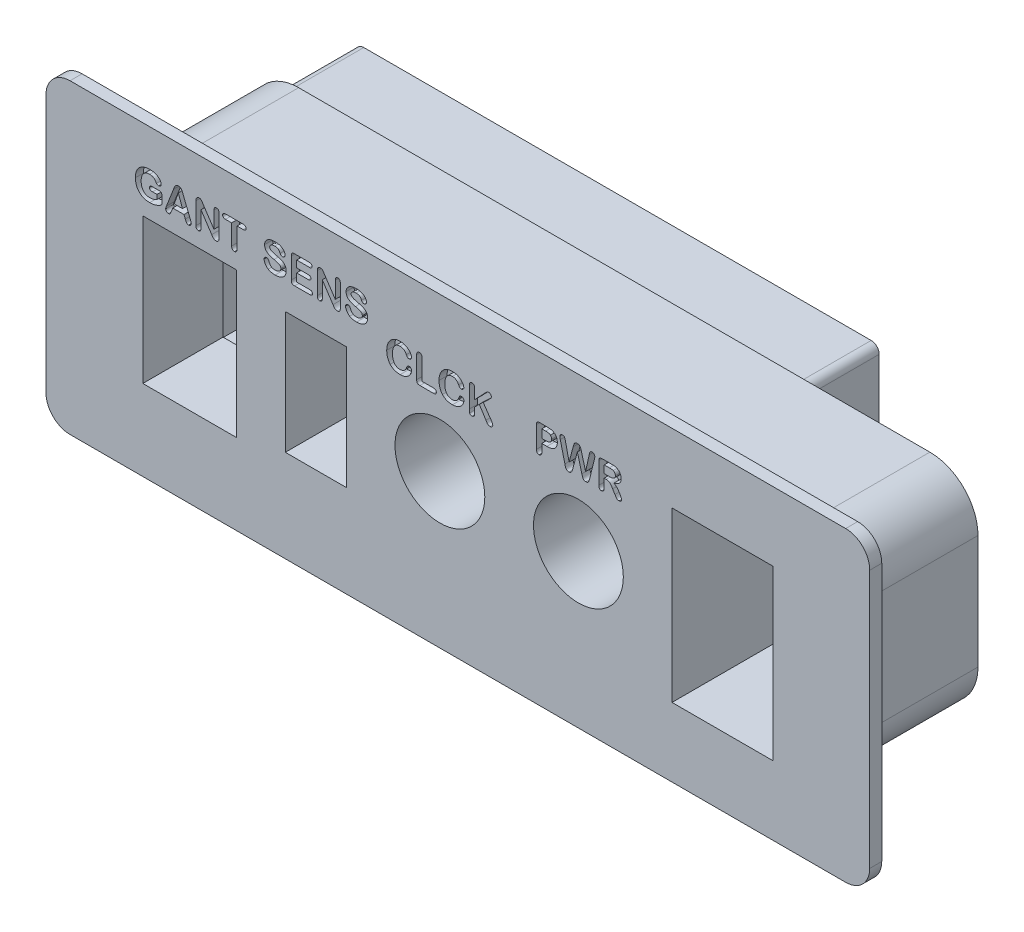
from build123d import *

# Parameters (mm, degrees)
SKETCH1_W           = 90.7
SKETCH1_H           = 26.2
BOSS_EXTRUDE1_DEPTH = 18
SKETCH2_W           = 102.7
SKETCH2_H           = 38.2
BOSS_EXTRUDE2_DEPTH = 1.5
FILLET1_R           = 6
FILLET2_R           = 3
SKETCH3_R           = 5.6
SKETCH3_W           = 7.6
SKETCH3_H           = 15.2
SKETCH3_W_2         = 11.7
SKETCH3_H_2         = 18.1
SKETCH3_W_3         = 12.6
SKETCH3_H_3         = 21
CUT_EXTRUDE1_DEPTH  = 59.153955154
CUT_EXTRUDE2_DEPTH  = 1
SKETCH5_W           = 12.3
SKETCH5_H           = 18.8
CUT_EXTRUDE3_DEPTH  = 9.5
SKETCH7_R           = 5.9
CUT_EXTRUDE4_DEPTH  = 10
SKETCH8_R           = 2.15
CUT_EXTRUDE5_DEPTH  = 10
SKETCH9_R           = 2.15
BOSS_EXTRUDE3_DEPTH = 10
FILLET3_R           = 1


with BuildPart() as part:
    # Sketch1 → Boss-Extrude1 (new body)
    with BuildSketch(Plane.XY):
        Rectangle(SKETCH1_W, SKETCH1_H)
    extrude(amount=-BOSS_EXTRUDE1_DEPTH)

    # Sketch2 → Boss-Extrude2 (add)
    with BuildSketch(Plane.XY):
        Rectangle(SKETCH2_W, SKETCH2_H)
    extrude(amount=BOSS_EXTRUDE2_DEPTH)

    # Fillet1
    fillet1_edges = [part.edges().sort_by_distance(p)[0] for p in [
        (-45.35, 13.1, -9),
        (-45.35, -13.1, -9),
        (45.35, -13.1, -9),
        (45.35, 13.1, -9),
    ]]
    fillet(fillet1_edges, radius=FILLET1_R)

    # Fillet2
    fillet2_edges = [part.edges().sort_by_distance(p)[0] for p in [
        (51.35, -19.1, 0.75),
        (-51.35, -19.1, 0.75),
        (-51.35, 19.1, 0.75),
        (51.35, 19.1, 0.75),
    ]]
    fillet(fillet2_edges, radius=FILLET2_R)

    # Sketch3 → Cut-Extrude1 (cut, through all)
    with BuildSketch(Plane.XY.offset(1.5)):
        with Locations((15.03, 0)):
            Circle(SKETCH3_R)
        with Locations((-2.24, 0)):
            Circle(SKETCH3_R)
        with Locations((-17.71, 0)):
            Rectangle(SKETCH3_W, SKETCH3_H)
        with Locations((-33.43, 0)):
            Rectangle(SKETCH3_W_2, SKETCH3_H_2)
        with Locations((33, 0)):
            Rectangle(SKETCH3_W_3, SKETCH3_H_3)
    extrude(amount=-CUT_EXTRUDE1_DEPTH, mode=Mode.SUBTRACT)

    # Sketch4 → Cut-Extrude2 (cut)
    # profile 1 of 15: a face of its own
    with BuildSketch(Plane.XY.offset(1.5)):
        with BuildLine():
            Line((-36.879299418, 12.372106147), (-36.879299418, 11.707052062))
            add(Edge.make_bspline(
                [(-36.879299418, 11.707052062), (-36.879455427, 11.685969761), (-36.879750607, 11.646080677), (-36.884937168, 11.589580463), (-36.892093147, 11.539666003), (-36.903418238, 11.49552608), (-36.919280994, 11.455912351), (-36.939895255, 11.418578453), (-36.966813531, 11.383749534), (-37.010708046, 11.338379399), (-37.078648552, 11.284285449), (-37.140029466, 11.248133631), (-37.172850218, 11.228803032)],
                knots=[0, 0, 0, 0, 1.05167989, 1.989846651, 2.829196185, 3.565931773, 4.257962754, 4.953534565, 5.687207176, 6.447374645, 8.100389424, 10, 10, 10, 10], degree=3))
            add(Edge.make_bspline(
                [(-37.172850218, 11.228803032), (-37.224756986, 11.201970775), (-37.326591923, 11.149329062), (-37.481156959, 11.082433036), (-37.632309677, 11.025493492), (-37.782473758, 10.980630125), (-37.934289889, 10.946527663), (-38.091303939, 10.922961837), (-38.254520631, 10.907740099), (-38.365746159, 10.905958595), (-38.422196803, 10.905054423)],
                knots=[0, 0, 0, 0, 1.07439078, 2.1078276, 3.0954898, 4.043555579, 4.987801064, 5.954741935, 6.961963702, 8, 8, 8, 8], degree=3))
            add(Edge.make_bspline(
                [(-38.422196803, 10.905054423), (-38.487818044, 10.906458076), (-38.616673772, 10.909214329), (-38.805281027, 10.93324452), (-38.985399318, 10.970386997), (-39.155592223, 11.024762567), (-39.315508588, 11.093364124), (-39.463652406, 11.176703883), (-39.60026232, 11.273058392), (-39.723643795, 11.384131441), (-39.834437366, 11.507997225), (-39.931068235, 11.645386644), (-40.013999007, 11.795030445), (-40.083641687, 11.956290229), (-40.138611655, 12.128658182), (-40.176398606, 12.311582956), (-40.201351727, 12.503914798), (-40.203946704, 12.635611852), (-40.205272115, 12.702877502)],
                knots=[0, 0, 0, 0, 1.100386502, 2.160750142, 3.184321939, 4.181582475, 5.152517567, 6.098441418, 7.027870255, 7.951106382, 8.87726923, 9.809903018, 10.762681596, 11.742383864, 12.752061269, 13.791813684, 14.872145711, 16, 16, 16, 16], degree=3))
            add(Edge.make_bspline(
                [(-40.205272115, 12.702877502), (-40.203790848, 12.769189739), (-40.200887542, 12.899162783), (-40.178014617, 13.089760035), (-40.140303861, 13.271741079), (-40.087050573, 13.444638723), (-40.019139671, 13.607111326), (-39.93693042, 13.757611148), (-39.839949739, 13.894851632), (-39.729262962, 14.019337633), (-39.604122442, 14.129729525), (-39.466441016, 14.22748513), (-39.315366677, 14.310177515), (-39.152076306, 14.379252881), (-38.977106961, 14.433857816), (-38.790468552, 14.473188462), (-38.5925074, 14.496485809), (-38.456671796, 14.499272802), (-38.387083071, 14.500700582)],
                knots=[0, 0, 0, 0, 1.098578105, 2.153230663, 3.175691274, 4.174419311, 5.14625478, 6.088916885, 7.010162605, 7.925016398, 8.842768463, 9.769420772, 10.717351455, 11.690695295, 12.702839522, 13.749673472, 14.847155329, 16, 16, 16, 16], degree=3))
            add(Edge.make_bspline(
                [(-38.387083071, 14.500700582), (-38.330151429, 14.499734854), (-38.219278614, 14.497854124), (-38.057898619, 14.480008882), (-37.906560519, 14.450851985), (-37.765909404, 14.410139712), (-37.637253441, 14.360023101), (-37.519695267, 14.305071668), (-37.415419466, 14.242696286), (-37.324525253, 14.173879993), (-37.244598568, 14.102191369), (-37.175930983, 14.027370029), (-37.115755024, 13.951715938), (-37.068643255, 13.873242448), (-37.031978086, 13.796463151), (-37.003181751, 13.723951673), (-36.987330552, 13.654671492), (-36.984557087, 13.609812491), (-36.983236065, 13.588445824)],
                knots=[0, 0, 0, 0, 1.493654161, 2.908850607, 4.254647133, 5.533949551, 6.745570033, 7.874969631, 8.935929066, 9.927474038, 10.862663671, 11.749528455, 12.590074434, 13.395023508, 14.145147076, 14.821757919, 15.438794752, 16, 16, 16, 16], degree=3))
            add(Edge.make_bspline(
                [(-36.983236065, 13.588445824), (-36.984510719, 13.567026386), (-36.987007021, 13.525078227), (-37.005023135, 13.464483167), (-37.036143453, 13.409482466), (-37.078152762, 13.360890032), (-37.128308323, 13.32027033), (-37.184467769, 13.290278781), (-37.245899426, 13.271682228), (-37.288592838, 13.269850568), (-37.310496047, 13.268910863)],
                knots=[0, 0, 0, 0, 1.011347772, 1.98063909, 2.956031586, 3.97569046, 4.998224318, 5.987747808, 6.967644449, 8, 8, 8, 8], degree=3))
            add(Edge.make_bspline(
                [(-37.310496047, 13.268910863), (-37.33508306, 13.270749845), (-37.384765503, 13.274465836), (-37.455419758, 13.30239051), (-37.519153365, 13.345938663), (-37.551772991, 13.385762014), (-37.56823084, 13.405854417)],
                knots=[0, 0, 0, 0, 0.973372159, 1.966872028, 2.974209188, 4, 4, 4, 4], degree=3))
            add(Edge.make_bspline(
                [(-37.56823084, 13.405854417), (-37.589068207, 13.438080618), (-37.628244945, 13.498669722), (-37.68694224, 13.581781382), (-37.739894618, 13.652887517), (-37.789758619, 13.713346364), (-37.840164902, 13.76679137), (-37.898895691, 13.812009124), (-37.964103116, 13.854470449), (-38.037941648, 13.891751623), (-38.120486332, 13.92418396), (-38.214317566, 13.946024409), (-38.318571394, 13.959384084), (-38.391720183, 13.960677945), (-38.429921824, 13.961353658)],
                knots=[0, 0, 0, 0, 1.270284042, 2.388285663, 3.367826865, 4.204273144, 4.982473651, 5.793364349, 6.651044596, 7.555617024, 8.527062579, 9.579629544, 10.735971918, 12, 12, 12, 12], degree=3))
            add(Edge.make_bspline(
                [(-38.429921824, 13.961353658), (-38.469996054, 13.960188746), (-38.548341965, 13.95791132), (-38.662615214, 13.942652074), (-38.770168618, 13.915770361), (-38.870986657, 13.878557451), (-38.964823819, 13.831187097), (-39.052013961, 13.774787652), (-39.131831504, 13.708215919), (-39.204391914, 13.632096176), (-39.268966869, 13.546577588), (-39.326584489, 13.452559162), (-39.374578876, 13.348593601), (-39.415331899, 13.236611132), (-39.446540922, 13.116607696), (-39.469889261, 12.990397884), (-39.48309593, 12.857423495), (-39.485111324, 12.766812628), (-39.486142883, 12.720434368)],
                knots=[0, 0, 0, 0, 1.044628969, 2.042270301, 2.998361366, 3.928992089, 4.837758762, 5.733129983, 6.630080197, 7.540791152, 8.468355801, 9.418625922, 10.40956343, 11.448096838, 12.521211322, 13.637926174, 14.790996301, 16, 16, 16, 16], degree=3))
            add(Edge.make_bspline(
                [(-39.486142883, 12.720434368), (-39.48542475, 12.670776992), (-39.484026355, 12.57408095), (-39.470590211, 12.433461953), (-39.448198381, 12.301798391), (-39.417614397, 12.178749664), (-39.377368019, 12.06460612), (-39.329207024, 11.958620884), (-39.271364271, 11.861723417), (-39.204505083, 11.774442898), (-39.129694874, 11.696837994), (-39.047944535, 11.628881927), (-38.958798155, 11.571570507), (-38.862432323, 11.525162256), (-38.759581649, 11.488502066), (-38.649624686, 11.462571607), (-38.532676467, 11.446893982), (-38.452210619, 11.445246114), (-38.410960409, 11.444401347)],
                knots=[0, 0, 0, 0, 1.258141377, 2.449933962, 3.575390538, 4.640093752, 5.658870901, 6.638339712, 7.585514639, 8.512181286, 9.418399795, 10.311632542, 11.200223959, 12.096995521, 13.016399166, 13.961733165, 14.955097869, 16, 16, 16, 16], degree=3))
            add(Edge.make_bspline(
                [(-38.410960409, 11.444401347), (-38.370430538, 11.445226671), (-38.290597896, 11.446852332), (-38.17282548, 11.459254352), (-38.058617115, 11.478462089), (-37.947648631, 11.507299569), (-37.838008409, 11.542746465), (-37.728336876, 11.585047543), (-37.618016216, 11.634218045), (-37.545360532, 11.671368858), (-37.508537496, 11.690197471)],
                knots=[0, 0, 0, 0, 1.028897666, 2.026643961, 3.003818171, 3.966807385, 4.934846124, 5.928298728, 6.95002941, 8, 8, 8, 8], degree=3))
            Line((-37.508537496, 11.690197471), (-37.508537496, 12.253421733))
            Line((-37.508537496, 12.253421733), (-38.059120814, 12.253421733))
            add(Edge.make_bspline(
                [(-38.059120814, 12.253421733), (-38.090315295, 12.253807132), (-38.14875632, 12.254529154), (-38.230292125, 12.267207034), (-38.300578665, 12.284113043), (-38.359295599, 12.310632844), (-38.405598189, 12.34755597), (-38.439563002, 12.395111739), (-38.458457673, 12.454351701), (-38.460461455, 12.496977013), (-38.461524183, 12.519583821)],
                knots=[0, 0, 0, 0, 1.358690867, 2.545427349, 3.590341975, 4.503704112, 5.331160324, 6.144067978, 7.015685797, 8, 8, 8, 8], degree=3))
            add(Edge.make_bspline(
                [(-38.461524183, 12.519583821), (-38.460796008, 12.538686606), (-38.459382331, 12.575772742), (-38.442061249, 12.628272171), (-38.415697766, 12.675768659), (-38.378920707, 12.717355187), (-38.332713828, 12.751238174), (-38.278392135, 12.776306739), (-38.216159507, 12.790008628), (-38.172485733, 12.791822766), (-38.149714243, 12.792768656)],
                knots=[0, 0, 0, 0, 0.980805911, 1.904136086, 2.816924439, 3.765675331, 4.740453241, 5.749851111, 6.826773133, 8, 8, 8, 8], degree=3))
            Line((-38.149714243, 12.792768656), (-37.354037075, 12.792768656))
            add(Edge.make_bspline(
                [(-37.354037075, 12.792768656), (-37.330619916, 12.792564085), (-37.285367562, 12.792168763), (-37.220378107, 12.787350141), (-37.161008505, 12.778950706), (-37.106867311, 12.767462499), (-37.057389776, 12.750153427), (-37.012893484, 12.724432178), (-36.973781184, 12.689930445), (-36.939596704, 12.647204762), (-36.911443448, 12.594428082), (-36.892375487, 12.530306642), (-36.881679693, 12.454865034), (-36.880128633, 12.400936816), (-36.879299418, 12.372106147)],
                knots=[0, 0, 0, 0, 1.134119292, 2.191622269, 3.153761991, 4.036816067, 4.868972684, 5.681903256, 6.509644808, 7.380899382, 8.319362442, 9.38811255, 10.603653811, 12, 12, 12, 12], degree=3))
        make_face()
    # profile 2 of 15: a face of its own
    with BuildSketch(Plane.XY.offset(1.5)):
        with BuildLine():
            Line((-33.982416526, 11.339762425), (-34.146748792, 11.759020386))
            Line((-34.146748792, 11.759020386), (-35.544977601, 11.759020386))
            Line((-35.544977601, 11.759020386), (-35.709309867, 11.330632855))
            add(Edge.make_bspline(
                [(-35.709309867, 11.330632855), (-35.724399423, 11.292094417), (-35.752056139, 11.221459692), (-35.794922802, 11.126725929), (-35.83377832, 11.052071446), (-35.869808917, 10.99409194), (-35.911835613, 10.951344476), (-35.964534283, 10.923957625), (-36.027429646, 10.907827982), (-36.072745863, 10.906020465), (-36.096965469, 10.905054423)],
                knots=[0, 0, 0, 0, 1.589179946, 2.912709847, 3.990397165, 4.820646782, 5.526248733, 6.26234321, 7.071295771, 8, 8, 8, 8], degree=3))
            add(Edge.make_bspline(
                [(-36.096965469, 10.905054423), (-36.11840814, 10.906262801), (-36.160694032, 10.908645775), (-36.221815243, 10.92799028), (-36.278875003, 10.958839683), (-36.330640075, 11.000538276), (-36.374357282, 11.049779028), (-36.406037173, 11.104523748), (-36.426354425, 11.162556774), (-36.428675675, 11.202890351), (-36.429843648, 11.223184835)],
                knots=[0, 0, 0, 0, 1.012468346, 1.996632184, 3.002236258, 4.065667855, 5.124941345, 6.097262832, 7.042607408, 8, 8, 8, 8], degree=3))
            add(Edge.make_bspline(
                [(-36.429843648, 11.223184835), (-36.428761173, 11.247395121), (-36.426537566, 11.297127561), (-36.410720626, 11.359840384), (-36.391730499, 11.414060546), (-36.374184395, 11.463234557), (-36.353343608, 11.520066389), (-36.337259486, 11.560087129), (-36.3287161, 11.581344902)],
                knots=[0, 0, 0, 0, 1.162779838, 2.388566498, 3.08974091, 3.926345762, 4.898539362, 6, 6, 6, 6], degree=3))
            Line((-36.3287161, 11.581344902), (-35.448765976, 13.839157871))
            add(Edge.make_bspline(
                [(-35.448765976, 13.839157871), (-35.442259389, 13.856265162), (-35.428690398, 13.891941116), (-35.406394788, 13.94759503), (-35.383763874, 14.008526619), (-35.358873174, 14.072490549), (-35.333544874, 14.136553179), (-35.305027518, 14.195902989), (-35.277511146, 14.250390021), (-35.247637264, 14.298907061), (-35.215092336, 14.342715322), (-35.177797012, 14.381408275), (-35.135530107, 14.415360901), (-35.089255678, 14.446052661), (-35.037097998, 14.470672102), (-34.979189086, 14.48832272), (-34.915656277, 14.498863378), (-34.871303795, 14.500073512), (-34.848321158, 14.500700582)],
                knots=[0, 0, 0, 0, 0.906149852, 1.889706515, 2.96811083, 4.12389095, 5.288239382, 6.376994434, 7.382631969, 8.308939681, 9.194397083, 10.07962691, 10.961131357, 11.874074475, 12.822804478, 13.805267996, 14.862730428, 16, 16, 16, 16], degree=3))
            add(Edge.make_bspline(
                [(-34.848321158, 14.500700582), (-34.82510163, 14.500079885), (-34.780278423, 14.498881685), (-34.716094299, 14.488247269), (-34.657748098, 14.471037517), (-34.606051321, 14.445746667), (-34.559444386, 14.415947592), (-34.517033409, 14.382541204), (-34.480142849, 14.343928538), (-34.437407685, 14.28729633), (-34.391431563, 14.210547912), (-34.352966666, 14.127720116), (-34.32507601, 14.054823702), (-34.298988874, 13.992357012), (-34.272157291, 13.920644189), (-34.25304127, 13.870051578), (-34.242960418, 13.843371518)],
                knots=[0, 0, 0, 0, 1.005463131, 1.940955953, 2.810500616, 3.631666672, 4.42517864, 5.204561669, 5.964968357, 6.731842121, 8.274852444, 9.831306624, 10.68267648, 11.656482744, 12.764143998, 14, 14, 14, 14], degree=3))
            Line((-34.242960418, 13.843371518), (-33.344048878, 11.600306317))
            add(Edge.make_bspline(
                [(-33.344048878, 11.600306317), (-33.335831591, 11.57971851), (-33.320007918, 11.540073463), (-33.297627754, 11.482839871), (-33.280941846, 11.429158467), (-33.264344377, 11.380764183), (-33.253747505, 11.335922104), (-33.244950939, 11.295995463), (-33.239514555, 11.260323477), (-33.238966226, 11.237948523), (-33.238707682, 11.227398483)],
                knots=[0, 0, 0, 0, 1.36622511, 2.630880465, 3.785062113, 4.829837655, 5.781525877, 6.621841003, 7.350182692, 8, 8, 8, 8], degree=3))
            add(Edge.make_bspline(
                [(-33.238707682, 11.227398483), (-33.239999204, 11.20760876), (-33.242591264, 11.167891155), (-33.261581064, 11.109605875), (-33.294550259, 11.055061688), (-33.337266783, 11.003917267), (-33.388665872, 10.960060307), (-33.447489793, 10.928188582), (-33.511351968, 10.9085442), (-33.555997577, 10.906227652), (-33.578608608, 10.905054423)],
                knots=[0, 0, 0, 0, 0.918533131, 1.843478885, 2.81316186, 3.862812883, 4.927781559, 5.930017069, 6.951644948, 8, 8, 8, 8], degree=3))
            add(Edge.make_bspline(
                [(-33.578608608, 10.905054423), (-33.604292498, 10.906182967), (-33.652682616, 10.908309217), (-33.719597337, 10.929900371), (-33.774433062, 10.965177322), (-33.813195473, 11.002902414), (-33.839862552, 11.040525209), (-33.860843443, 11.075084931), (-33.882522368, 11.115938803), (-33.91139171, 11.177050606), (-33.943886544, 11.252742584), (-33.970195473, 11.312161215), (-33.982416526, 11.339762425)],
                knots=[0, 0, 0, 0, 1.202315025, 2.265239587, 3.252603888, 4.239051274, 4.781746036, 5.412840692, 6.135219166, 6.950797606, 8.583580985, 10, 10, 10, 10], degree=3))
        make_face()
        Polygon((-35.362386195, 12.29836731), (-34.334256121, 12.29836731), (-34.853237081, 13.736625773), align=None, mode=Mode.SUBTRACT)
    # profile 3 of 15: a face of its own
    with BuildSketch(Plane.XY.offset(1.5)):
        with BuildLine():
            Line((-31.773762782, 14.078633523), (-30.407136332, 12.028693848))
            Line((-30.407136332, 12.028693848), (-30.407136332, 14.097594938))
            add(Edge.make_bspline(
                [(-30.407136332, 14.097594938), (-30.406081306, 14.129263011), (-30.404105194, 14.188578723), (-30.389092657, 14.271744952), (-30.362787511, 14.342293297), (-30.325511225, 14.400227672), (-30.279165513, 14.445539899), (-30.224443308, 14.47773015), (-30.162420912, 14.497457328), (-30.118650718, 14.499595497), (-30.096028666, 14.500700582)],
                knots=[0, 0, 0, 0, 1.319117216, 2.470765316, 3.505116792, 4.43580569, 5.318756254, 6.18027265, 7.059497782, 8, 8, 8, 8], degree=3))
            add(Edge.make_bspline(
                [(-30.096028666, 14.500700582), (-30.072718312, 14.499574746), (-30.02759902, 14.49739559), (-29.963792013, 14.478069968), (-29.908024467, 14.445545601), (-29.860945358, 14.400294166), (-29.822989561, 14.342357803), (-29.795760738, 14.271895704), (-29.780989317, 14.188558314), (-29.778974138, 14.129255908), (-29.777898254, 14.097594938)],
                knots=[0, 0, 0, 0, 0.959871134, 1.857917088, 2.719075999, 3.600089629, 4.526699118, 5.554128738, 6.694173474, 8, 8, 8, 8], degree=3))
            Line((-29.777898254, 14.097594938), (-29.777898254, 11.362937489))
            add(Edge.make_bspline(
                [(-29.777898254, 11.362937489), (-29.778765796, 11.327041731), (-29.78039407, 11.259669549), (-29.797741495, 11.165465598), (-29.826996701, 11.085280609), (-29.867929179, 11.018750468), (-29.921802274, 10.966553696), (-29.988402789, 10.930676305), (-30.066054265, 10.908268395), (-30.121613584, 10.906161466), (-30.150806088, 10.905054423)],
                knots=[0, 0, 0, 0, 1.276164049, 2.395212213, 3.391561633, 4.297456637, 5.151673506, 6.027862746, 6.963780962, 8, 8, 8, 8], degree=3))
            add(Edge.make_bspline(
                [(-30.150806088, 10.905054423), (-30.180402734, 10.90644309), (-30.237486741, 10.909121457), (-30.31972218, 10.928675927), (-30.39449254, 10.965156884), (-30.461675161, 11.017906086), (-30.52456877, 11.081881949), (-30.582137865, 11.156087893), (-30.636376182, 11.23648339), (-30.673497895, 11.290626878), (-30.692259836, 11.317991912)],
                knots=[0, 0, 0, 0, 0.990229924, 1.909888509, 2.806876858, 3.75171819, 4.754420985, 5.802993103, 6.889595585, 8, 8, 8, 8], degree=3))
            Line((-30.692259836, 11.317991912), (-32.025177104, 13.33211558))
            Line((-32.025177104, 13.33211558), (-32.025177104, 11.306053243))
            add(Edge.make_bspline(
                [(-32.025177104, 11.306053243), (-32.026229688, 11.275090429), (-32.02822355, 11.216438978), (-32.043619, 11.133964944), (-32.071941059, 11.063545832), (-32.110853464, 11.005635792), (-32.158637958, 10.960577922), (-32.213265956, 10.92813943), (-32.274567103, 10.908356437), (-32.317642998, 10.906175856), (-32.339796143, 10.905054423)],
                knots=[0, 0, 0, 0, 1.293064309, 2.449392962, 3.484384031, 4.441729672, 5.340986808, 6.204611779, 7.076664708, 8, 8, 8, 8], degree=3))
            add(Edge.make_bspline(
                [(-32.339796143, 10.905054423), (-32.362420026, 10.906133884), (-32.406488462, 10.908236535), (-32.468867941, 10.928559135), (-32.52373145, 10.962097902), (-32.571643095, 11.007410145), (-32.608922899, 11.066412499), (-32.635550217, 11.136834912), (-32.651542982, 11.218733641), (-32.653420252, 11.277182777), (-32.654415181, 11.308160067)],
                knots=[0, 0, 0, 0, 0.938889884, 1.828837584, 2.693878765, 3.596100726, 4.546832571, 5.570326044, 6.712304089, 8, 8, 8, 8], degree=3))
            Line((-32.654415181, 11.308160067), (-32.654415181, 13.990849193))
            add(Edge.make_bspline(
                [(-32.654415181, 13.990849193), (-32.65415171, 14.017795331), (-32.65365351, 14.06874794), (-32.646284707, 14.140492717), (-32.636215246, 14.203634984), (-32.623732965, 14.24144167), (-32.6178969, 14.259118106)],
                knots=[0, 0, 0, 0, 1.18793306, 2.246269525, 3.180047019, 4, 4, 4, 4], degree=3))
            add(Edge.make_bspline(
                [(-32.6178969, 14.259118106), (-32.610065665, 14.276318033), (-32.594431039, 14.310656729), (-32.560147971, 14.356156834), (-32.521018805, 14.398563035), (-32.473796771, 14.433499329), (-32.422845443, 14.463191678), (-32.368808797, 14.485136829), (-32.312332731, 14.498310786), (-32.27408481, 14.499900107), (-32.254820911, 14.500700582)],
                knots=[0, 0, 0, 0, 0.980600708, 1.957714689, 2.948627098, 3.97434472, 5.000279326, 6.011426356, 6.998437519, 8, 8, 8, 8], degree=3))
            add(Edge.make_bspline(
                [(-32.254820911, 14.500700582), (-32.226035046, 14.499555353), (-32.172056291, 14.497407839), (-32.097626268, 14.472548261), (-32.034264303, 14.43610634), (-31.979471669, 14.386364477), (-31.927663805, 14.324890017), (-31.879647384, 14.249101568), (-31.827651209, 14.1658415), (-31.791999588, 14.10814626), (-31.773762782, 14.078633523)],
                knots=[0, 0, 0, 0, 1.01695463, 1.906975685, 2.751376853, 3.592506721, 4.517315556, 5.594915983, 6.76973195, 8, 8, 8, 8], degree=3))
        make_face()
    # profile 4 of 15: a face of its own
    with BuildSketch(Plane.XY.offset(1.5)):
        with BuildLine():
            Line((-26.763033223, 13.826516927), (-27.530619405, 13.826516927))
            Line((-27.530619405, 13.826516927), (-27.530619405, 11.329228306))
            add(Edge.make_bspline(
                [(-27.530619405, 11.329228306), (-27.53145149, 11.295422796), (-27.533007731, 11.232196706), (-27.550715398, 11.14389744), (-27.579395346, 11.068877515), (-27.621162402, 11.008311469), (-27.671791545, 10.96167177), (-27.730256035, 10.928750422), (-27.795656182, 10.908128703), (-27.841804041, 10.906100468), (-27.865604409, 10.905054423)],
                knots=[0, 0, 0, 0, 1.324771526, 2.4777063, 3.516495944, 4.454151167, 5.338361256, 6.19400724, 7.068574513, 8, 8, 8, 8], degree=3))
            add(Edge.make_bspline(
                [(-27.865604409, 10.905054423), (-27.889670435, 10.906009347), (-27.936407864, 10.907863857), (-28.00229448, 10.929856186), (-28.062364039, 10.961999548), (-28.113430835, 11.009830284), (-28.155980481, 11.070300443), (-28.18371799, 11.145762675), (-28.202633341, 11.23301535), (-28.204050714, 11.295866623), (-28.20480306, 11.329228306)],
                knots=[0, 0, 0, 0, 0.936591527, 1.818907611, 2.686883908, 3.580272073, 4.52668274, 5.549195867, 6.699104295, 8, 8, 8, 8], degree=3))
            Line((-28.20480306, 11.329228306), (-28.20480306, 13.826516927))
            Line((-28.20480306, 13.826516927), (-28.973091516, 13.826516927))
            add(Edge.make_bspline(
                [(-28.973091516, 13.826516927), (-29.001281105, 13.827216406), (-29.054170545, 13.828528771), (-29.127577636, 13.844428766), (-29.190576232, 13.868311201), (-29.241551128, 13.904237446), (-29.280557674, 13.948418862), (-29.309047547, 13.999049184), (-29.325260502, 14.056357645), (-29.327360925, 14.096558311), (-29.328442485, 14.117258628)],
                knots=[0, 0, 0, 0, 1.298175259, 2.435642608, 3.448405227, 4.386245553, 5.281324188, 6.14672195, 7.045701294, 8, 8, 8, 8], degree=3))
            add(Edge.make_bspline(
                [(-29.328442485, 14.117258628), (-29.327542076, 14.138939665), (-29.325805814, 14.180747309), (-29.307464986, 14.239336086), (-29.278920811, 14.291148127), (-29.23787597, 14.334349755), (-29.186315255, 14.369453002), (-29.123900701, 14.393628059), (-29.051737701, 14.408474752), (-29.00032644, 14.410000937), (-28.973091516, 14.410809428)],
                knots=[0, 0, 0, 0, 0.993926626, 1.916593339, 2.793690024, 3.692250099, 4.629614642, 5.63892321, 6.749228366, 8, 8, 8, 8], degree=3))
            Line((-28.973091516, 14.410809428), (-26.763033223, 14.410809428))
            add(Edge.make_bspline(
                [(-26.763033223, 14.410809428), (-26.734381905, 14.410084341), (-26.680577582, 14.4087227), (-26.605859758, 14.393127519), (-26.54203289, 14.368515264), (-26.491334711, 14.331401179), (-26.450975563, 14.287707749), (-26.42328304, 14.236135471), (-26.405605441, 14.178799948), (-26.403733764, 14.138228953), (-26.402766333, 14.117258628)],
                knots=[0, 0, 0, 0, 1.304496451, 2.449714448, 3.464685333, 4.39788137, 5.28974218, 6.154486031, 7.046091257, 8, 8, 8, 8], degree=3))
            add(Edge.make_bspline(
                [(-26.402766333, 14.117258628), (-26.4037844, 14.096542855), (-26.405764765, 14.0562461), (-26.422926528, 13.998977916), (-26.452090444, 13.94837533), (-26.491815628, 13.904207874), (-26.543483745, 13.868313696), (-26.607370829, 13.844322534), (-26.681515419, 13.828655386), (-26.734850583, 13.827256243), (-26.763033223, 13.826516927)],
                knots=[0, 0, 0, 0, 0.94771637, 1.843517728, 2.708217129, 3.604275273, 4.544436114, 5.560171289, 6.710778986, 8, 8, 8, 8], degree=3))
        make_face()
    # profile 5 of 15: a face of its own
    with BuildSketch(Plane.XY.offset(1.5)):
        with BuildLine():
            add(Edge.make_bspline(
                [(-21.395537313, 12.026587024), (-21.396115781, 12.000115901), (-21.397259814, 11.947764118), (-21.405196126, 11.870337716), (-21.41781581, 11.795029771), (-21.435197094, 11.72167087), (-21.458582647, 11.650644282), (-21.486948397, 11.581528496), (-21.519523334, 11.513994161), (-21.558706358, 11.449361403), (-21.601676015, 11.38708128), (-21.650099649, 11.328401191), (-21.70243568, 11.272740568), (-21.760725652, 11.221437219), (-21.823062715, 11.17304084), (-21.890086024, 11.127858627), (-21.961944069, 11.086452535), (-22.038355028, 11.04856525), (-22.119125829, 11.014982247), (-22.203578758, 10.985621704), (-22.291500847, 10.959715064), (-22.383556409, 10.941070885), (-22.47872921, 10.924138918), (-22.577980373, 10.913489613), (-22.680818598, 10.906020842), (-22.750678936, 10.905379208), (-22.786041101, 10.905054423)],
                knots=[0, 0, 0, 0, 0.94904565, 1.876922008, 2.787632434, 3.685409961, 4.577243309, 5.465673456, 6.362823001, 7.262481841, 8.172882791, 9.073480814, 9.987781212, 10.909257821, 11.854472834, 12.815908446, 13.804938933, 14.825933836, 15.871877953, 16.938992789, 18.030809531, 19.155177508, 20.304610591, 21.495671913, 22.732349945, 24, 24, 24, 24], degree=3))
            add(Edge.make_bspline(
                [(-22.786041101, 10.905054423), (-22.828189217, 10.905848275), (-22.910944903, 10.907406962), (-23.032265422, 10.91609148), (-23.147756669, 10.932685713), (-23.257951279, 10.954001525), (-23.36243304, 10.982677254), (-23.460994271, 11.018209581), (-23.554640281, 11.058222955), (-23.612674718, 11.091522747), (-23.641411613, 11.108011794)],
                knots=[0, 0, 0, 0, 1.136969792, 2.232382444, 3.278022597, 4.282276305, 5.258039159, 6.196692155, 7.1070566, 8, 8, 8, 8], degree=3))
            add(Edge.make_bspline(
                [(-23.641411613, 11.108011794), (-23.678655327, 11.132574767), (-23.752759784, 11.181448134), (-23.851081293, 11.271817874), (-23.940553871, 11.371599112), (-24.016448513, 11.482204623), (-24.078613071, 11.597321828), (-24.124358526, 11.713127974), (-24.152531796, 11.82790733), (-24.156394893, 11.904246402), (-24.158285748, 11.941611792)],
                knots=[0, 0, 0, 0, 1.048405233, 2.086029851, 3.131870059, 4.19698972, 5.234628962, 6.204463721, 7.121145791, 8, 8, 8, 8], degree=3))
            add(Edge.make_bspline(
                [(-24.158285748, 11.941611792), (-24.157217897, 11.96255559), (-24.155132318, 12.003460136), (-24.138394235, 12.06221136), (-24.110994117, 12.115898048), (-24.074133718, 12.164304313), (-24.027942111, 12.20424126), (-23.974889094, 12.233591808), (-23.915804031, 12.252129743), (-23.874238953, 12.253908601), (-23.85279628, 12.254826282)],
                knots=[0, 0, 0, 0, 1.029346977, 2.010378973, 2.978887221, 3.98112847, 4.985683985, 5.960201932, 6.947705008, 8, 8, 8, 8], degree=3))
            add(Edge.make_bspline(
                [(-23.85279628, 12.254826282), (-23.835373928, 12.254149681), (-23.801608907, 12.252838408), (-23.753137009, 12.238711434), (-23.709040138, 12.21600197), (-23.669137555, 12.183989774), (-23.632331483, 12.144319796), (-23.599429004, 12.095386748), (-23.568312974, 12.038693404), (-23.551747705, 11.996606859), (-23.543093163, 11.9746187)],
                knots=[0, 0, 0, 0, 0.932433643, 1.807083439, 2.683354794, 3.577798377, 4.537574086, 5.575745438, 6.73344572, 8, 8, 8, 8], degree=3))
            add(Edge.make_bspline(
                [(-23.543093163, 11.9746187), (-23.531589496, 11.948079335), (-23.509385863, 11.896854769), (-23.473912732, 11.823944172), (-23.435423473, 11.758856594), (-23.397212223, 11.698408082), (-23.352809944, 11.644206444), (-23.30003, 11.596524472), (-23.239967729, 11.552641114), (-23.171331018, 11.5136412), (-23.092817305, 11.481426413), (-23.002708873, 11.460761312), (-22.902399241, 11.446048584), (-22.831517113, 11.444966783), (-22.794468397, 11.444401347)],
                knots=[0, 0, 0, 0, 1.049400523, 2.025484958, 2.938775158, 3.791458515, 4.617854192, 5.471340711, 6.364831691, 7.311813007, 8.329001391, 9.430967745, 10.65721654, 12, 12, 12, 12], degree=3))
            add(Edge.make_bspline(
                [(-22.794468397, 11.444401347), (-22.768230643, 11.444718174), (-22.716826258, 11.445338894), (-22.641803739, 11.452754969), (-22.570338706, 11.463538032), (-22.503197965, 11.480131581), (-22.439104582, 11.499201013), (-22.379506647, 11.524993692), (-22.323173899, 11.554226311), (-22.271248381, 11.587926256), (-22.224219634, 11.625068002), (-22.182682466, 11.664751224), (-22.147859257, 11.707281016), (-22.119693037, 11.752001526), (-22.096556617, 11.798327626), (-22.081584443, 11.847518529), (-22.070827914, 11.898539185), (-22.070094459, 11.933593293), (-22.069720968, 11.951443637)],
                knots=[0, 0, 0, 0, 1.280104897, 2.507951138, 3.676307556, 4.80418709, 5.881088807, 6.935759984, 7.968101261, 8.975871649, 9.951925376, 10.889226907, 11.77430911, 12.626938706, 13.464975202, 14.292430499, 15.130466995, 16, 16, 16, 16], degree=3))
            add(Edge.make_bspline(
                [(-22.069720968, 11.951443637), (-22.070996008, 11.978975363), (-22.073453843, 12.032046991), (-22.09442355, 12.107324928), (-22.128620066, 12.174659212), (-22.177765808, 12.232253077), (-22.236660697, 12.282666453), (-22.303627859, 12.327110551), (-22.378967327, 12.364151065), (-22.462888122, 12.396027622), (-22.558200301, 12.424197083), (-22.666124013, 12.454879888), (-22.789130795, 12.484350518), (-22.875915246, 12.504215304), (-22.921580106, 12.514667899)],
                knots=[0, 0, 0, 0, 0.889216893, 1.714102054, 2.506617733, 3.313297162, 4.145346194, 5.008548814, 5.905982136, 6.85524107, 7.90915739, 9.119934543, 10.484546625, 12, 12, 12, 12], degree=3))
            add(Edge.make_bspline(
                [(-22.921580106, 12.514667899), (-22.981410435, 12.529363511), (-23.096554374, 12.557645333), (-23.260416356, 12.60677052), (-23.408999936, 12.659517619), (-23.544030345, 12.714911832), (-23.664816114, 12.778951326), (-23.772401916, 12.853093612), (-23.866034739, 12.938637515), (-23.934151211, 13.018046674), (-23.979914368, 13.087376216), (-24.010501409, 13.142323102), (-24.035667855, 13.200734249), (-24.055947107, 13.262155763), (-24.072080497, 13.326240223), (-24.084157582, 13.39330503), (-24.091247576, 13.463520102), (-24.091926558, 13.511413536), (-24.092271932, 13.535775226)],
                knots=[0, 0, 0, 0, 1.736501148, 3.341910126, 4.819600125, 6.179978285, 7.452384316, 8.666026066, 9.852526874, 11.018500134, 11.604160195, 12.191898388, 12.788898658, 13.394048862, 14.013423104, 14.650267458, 15.313438986, 16, 16, 16, 16], degree=3))
            add(Edge.make_bspline(
                [(-24.092271932, 13.535775226), (-24.092021147, 13.559213628), (-24.091525652, 13.605522712), (-24.082919248, 13.673932053), (-24.071854133, 13.740625582), (-24.053493216, 13.804900586), (-24.032057338, 13.86752022), (-24.005381817, 13.928330373), (-23.972662531, 13.986363895), (-23.936424613, 14.042880194), (-23.894690183, 14.09612125), (-23.848934273, 14.147053295), (-23.798406017, 14.194699114), (-23.743506961, 14.238785633), (-23.684879149, 14.280045938), (-23.621249373, 14.317179394), (-23.553284648, 14.35122345), (-23.456312386, 14.394407159), (-23.324827689, 14.437375905), (-23.155986152, 14.47470905), (-22.973867132, 14.496220642), (-22.848131973, 14.499175428), (-22.783232002, 14.500700582)],
                knots=[0, 0, 0, 0, 0.769447055, 1.520256708, 2.262508943, 2.988321943, 3.713156319, 4.436274914, 5.166110871, 5.89994773, 6.639925254, 7.385953261, 8.147635144, 8.918771606, 9.697541001, 10.500837489, 11.336648996, 12.194084557, 13.986552036, 15.869357873, 17.867910982, 20, 20, 20, 20], degree=3))
            add(Edge.make_bspline(
                [(-22.783232002, 14.500700582), (-22.731459511, 14.499831955), (-22.631435641, 14.498153778), (-22.486797452, 14.483194667), (-22.353023965, 14.459133968), (-22.230081962, 14.424772467), (-22.118255459, 14.381037783), (-22.014829229, 14.333642907), (-21.922707475, 14.276808504), (-21.840313151, 14.215048472), (-21.768326941, 14.149435858), (-21.706520495, 14.081445796), (-21.654764821, 14.012035436), (-21.614152277, 13.940679873), (-21.582181103, 13.869678815), (-21.559530012, 13.799040665), (-21.545380055, 13.729001606), (-21.543796384, 13.682379374), (-21.543014987, 13.659375563)],
                knots=[0, 0, 0, 0, 1.501690988, 2.90125006, 4.213360721, 5.441058994, 6.597662568, 7.694391675, 8.736870916, 9.731158549, 10.678212085, 11.558107852, 12.393499291, 13.184506524, 13.935459515, 14.648542639, 15.3331793, 16, 16, 16, 16], degree=3))
            add(Edge.make_bspline(
                [(-21.543014987, 13.659375563), (-21.544112561, 13.638901107), (-21.546280038, 13.598468352), (-21.563195859, 13.539509561), (-21.591109522, 13.484262028), (-21.62868483, 13.433521434), (-21.674061765, 13.390032432), (-21.726802787, 13.358300075), (-21.785063028, 13.33823686), (-21.826102308, 13.336045751), (-21.847099907, 13.334924679)],
                knots=[0, 0, 0, 0, 0.996822281, 1.968514991, 2.963507279, 3.999520829, 5.032703306, 6.005199511, 6.979367534, 8, 8, 8, 8], degree=3))
            add(Edge.make_bspline(
                [(-21.847099907, 13.334924679), (-21.865644558, 13.335563926), (-21.900683472, 13.336771741), (-21.949773814, 13.346588933), (-21.992186033, 13.362469061), (-22.028465238, 13.386370777), (-22.060624704, 13.418179985), (-22.092558865, 13.457446037), (-22.127374492, 13.503545785), (-22.148905537, 13.538383614), (-22.160314396, 13.556843465)],
                knots=[0, 0, 0, 0, 1.091449335, 2.062222683, 2.935356023, 3.742291246, 4.60049062, 5.589116983, 6.722522559, 8, 8, 8, 8], degree=3))
            add(Edge.make_bspline(
                [(-22.160314396, 13.556843465), (-22.17677166, 13.590653378), (-22.208527522, 13.655892833), (-22.264885022, 13.745201327), (-22.327165594, 13.821961616), (-22.382884605, 13.878384031), (-22.432026355, 13.917214645), (-22.474907265, 13.940910369), (-22.5225787, 13.960930624), (-22.575077147, 13.978185237), (-22.633044022, 13.9903999), (-22.696156326, 13.999386114), (-22.764404466, 14.005037315), (-22.811545977, 14.005869348), (-22.8359026, 14.006299235)],
                knots=[0, 0, 0, 0, 1.547925219, 2.986869477, 4.337480217, 5.612327564, 6.244828973, 6.909713596, 7.622436063, 8.372459485, 9.181850378, 10.058552105, 10.996911345, 12, 12, 12, 12], degree=3))
            add(Edge.make_bspline(
                [(-22.8359026, 14.006299235), (-22.880697179, 14.004813943), (-22.96618206, 14.001979448), (-23.088126218, 13.980726585), (-23.196190565, 13.942567695), (-23.275507219, 13.898544071), (-23.330855475, 13.858095274), (-23.365739878, 13.825662836), (-23.39609506, 13.792556065), (-23.41994967, 13.757053404), (-23.439051297, 13.7203191), (-23.453729576, 13.682090908), (-23.461155295, 13.641871557), (-23.462407359, 13.614688409), (-23.463033854, 13.601086768)],
                knots=[0, 0, 0, 0, 1.954508865, 3.729936959, 5.377867423, 6.932763574, 7.670377485, 8.364471239, 9.008409927, 9.626125187, 10.224705099, 10.812996495, 11.406058616, 12, 12, 12, 12], degree=3))
            add(Edge.make_bspline(
                [(-23.463033854, 13.601086768), (-23.462438319, 13.58440063), (-23.461266424, 13.551565652), (-23.44969904, 13.504308782), (-23.431018647, 13.460530841), (-23.405530576, 13.420121285), (-23.372868344, 13.383578149), (-23.334027664, 13.35082225), (-23.29160648, 13.318599473), (-23.226309988, 13.282142959), (-23.141223344, 13.242305735), (-23.050071678, 13.210678813), (-22.967822434, 13.188604537), (-22.889265638, 13.168526732), (-22.793968477, 13.143566252), (-22.724510113, 13.126911252), (-22.687020377, 13.117921815)],
                knots=[0, 0, 0, 0, 0.710476229, 1.398074961, 2.059979244, 2.732930957, 3.425942516, 4.140543967, 4.897202213, 5.693324271, 7.323324828, 8.898613798, 9.799484583, 10.954336094, 12.356121149, 14, 14, 14, 14], degree=3))
            add(Edge.make_bspline(
                [(-22.687020377, 13.117921815), (-22.639213079, 13.106426883), (-22.545690218, 13.083939961), (-22.409125468, 13.047352989), (-22.279505294, 13.009066021), (-22.156967143, 12.968205159), (-22.041981595, 12.925680119), (-21.936074504, 12.877509894), (-21.838790662, 12.825845788), (-21.75010872, 12.769002169), (-21.670819056, 12.705198889), (-21.599565794, 12.634955773), (-21.539088831, 12.555384747), (-21.487371997, 12.468385914), (-21.445023303, 12.372534266), (-21.416052739, 12.266066292), (-21.398295309, 12.149617006), (-21.396478166, 12.068557031), (-21.395537313, 12.026587024)],
                knots=[0, 0, 0, 0, 1.267502217, 2.479546844, 3.644246111, 4.751070339, 5.809111578, 6.802976886, 7.747931384, 8.64678748, 9.513844361, 10.367269951, 11.219414442, 12.082556445, 12.971635876, 13.911644553, 14.918722911, 16, 16, 16, 16], degree=3))
        make_face()
    # profile 6 of 15: a face of its own
    with BuildSketch(Plane.XY.offset(1.5)):
        with BuildLine():
            Line((-18.506379442, 13.871462504), (-20.09211558, 13.871462504))
            Line((-20.09211558, 13.871462504), (-20.09211558, 13.017496541))
            Line((-20.09211558, 13.017496541), (-18.632086603, 13.017496541))
            add(Edge.make_bspline(
                [(-18.632086603, 13.017496541), (-18.606750429, 13.016537675), (-18.559192961, 13.014737828), (-18.492621515, 13.00200679), (-18.436320643, 12.978639592), (-18.390517524, 12.946031448), (-18.355340521, 12.905474766), (-18.329481951, 12.859240266), (-18.314364523, 12.806326654), (-18.31270984, 12.769224097), (-18.311849367, 12.749929903)],
                knots=[0, 0, 0, 0, 1.285293232, 2.412569968, 3.418386025, 4.354403319, 5.23810445, 6.120527863, 7.022630715, 8, 8, 8, 8], degree=3))
            add(Edge.make_bspline(
                [(-18.311849367, 12.749929903), (-18.312685666, 12.730623887), (-18.31429386, 12.693498597), (-18.329763816, 12.640652965), (-18.354667842, 12.593447027), (-18.389508203, 12.552037336), (-18.434932076, 12.518226715), (-18.491375685, 12.494276981), (-18.55841604, 12.480721284), (-18.60650545, 12.479042596), (-18.632086603, 12.478149618)],
                knots=[0, 0, 0, 0, 0.971200242, 1.867609123, 2.749214551, 3.645234956, 4.57279535, 5.576919765, 6.711042891, 8, 8, 8, 8], degree=3))
            Line((-18.632086603, 12.478149618), (-20.09211558, 12.478149618))
            Line((-20.09211558, 12.478149618), (-20.09211558, 11.489346924))
            Line((-20.09211558, 11.489346924), (-18.45160202, 11.489346924))
            add(Edge.make_bspline(
                [(-18.45160202, 11.489346924), (-18.425569067, 11.488372825), (-18.3766299, 11.486541622), (-18.307649735, 11.473896223), (-18.249193566, 11.449875583), (-18.200922861, 11.4169915), (-18.162776083, 11.376630425), (-18.136537138, 11.328636917), (-18.119493201, 11.275123631), (-18.118058262, 11.237131826), (-18.117319291, 11.217566638)],
                knots=[0, 0, 0, 0, 1.281412047, 2.408917619, 3.431661904, 4.368016538, 5.264760761, 6.136510243, 7.040331808, 8, 8, 8, 8], degree=3))
            add(Edge.make_bspline(
                [(-18.117319291, 11.217566638), (-18.118019703, 11.198454507), (-18.119371269, 11.161574296), (-18.136844688, 11.109598316), (-18.162965757, 11.062592396), (-18.200930529, 11.022406101), (-18.249030985, 10.989271731), (-18.307922085, 10.966574836), (-18.376499801, 10.952468968), (-18.425540089, 10.95085678), (-18.45160202, 10.95)],
                knots=[0, 0, 0, 0, 0.944744106, 1.823049547, 2.692159438, 3.596595969, 4.540982691, 5.5681055, 6.707595947, 8, 8, 8, 8], degree=3))
            Line((-18.45160202, 10.95), (-20.353361746, 10.95))
            add(Edge.make_bspline(
                [(-20.353361746, 10.95), (-20.387643969, 10.95099766), (-20.45143942, 10.952854195), (-20.539827667, 10.971713234), (-20.613501011, 11.002906784), (-20.67304902, 11.048797131), (-20.716098516, 11.111112363), (-20.746154213, 11.187417472), (-20.762916306, 11.278888842), (-20.765119649, 11.344608367), (-20.766299235, 11.37979208)],
                knots=[0, 0, 0, 0, 1.189456171, 2.21344733, 3.119993849, 3.948013107, 4.78741338, 5.71757596, 6.778077714, 8, 8, 8, 8], degree=3))
            Line((-20.766299235, 11.37979208), (-20.766299235, 13.981017348))
            add(Edge.make_bspline(
                [(-20.766299235, 13.981017348), (-20.765759321, 14.005151036), (-20.764734084, 14.050978212), (-20.757108712, 14.116395413), (-20.744134326, 14.174963153), (-20.725046949, 14.226951608), (-20.700678449, 14.27271216), (-20.669075894, 14.311440996), (-20.631307025, 14.343274706), (-20.587686427, 14.369102288), (-20.537579474, 14.387568919), (-20.481886021, 14.401936336), (-20.419559152, 14.409106629), (-20.376082666, 14.410224977), (-20.353361746, 14.410809428)],
                knots=[0, 0, 0, 0, 1.257097402, 2.387087425, 3.425508426, 4.374733264, 5.264346199, 6.113849079, 6.961774747, 7.825601221, 8.740599092, 9.73444991, 10.816017894, 12, 12, 12, 12], degree=3))
            Line((-20.353361746, 14.410809428), (-18.506379442, 14.410809428))
            add(Edge.make_bspline(
                [(-18.506379442, 14.410809428), (-18.480121278, 14.409814658), (-18.430734637, 14.407943683), (-18.361392521, 14.395617039), (-18.303313392, 14.371260908), (-18.255512207, 14.338728601), (-18.21956225, 14.297782491), (-18.19225263, 14.251619674), (-18.176730782, 14.198753841), (-18.175060358, 14.161598723), (-18.174203537, 14.142540515)],
                knots=[0, 0, 0, 0, 1.304353081, 2.453241492, 3.474309848, 4.409392115, 5.298405909, 6.157667996, 7.055001114, 8, 8, 8, 8], degree=3))
            add(Edge.make_bspline(
                [(-18.174203537, 14.142540515), (-18.175026895, 14.123004128), (-18.176622855, 14.085135643), (-18.192462952, 14.031288354), (-18.219097286, 13.98397275), (-18.255586316, 13.942921542), (-18.303139005, 13.910148523), (-18.361587717, 13.886886311), (-18.430702225, 13.874253049), (-18.480110027, 13.87243117), (-18.506379442, 13.871462504)],
                knots=[0, 0, 0, 0, 0.962139494, 1.864969442, 2.738963821, 3.622448103, 4.551714319, 5.562017248, 6.70375977, 8, 8, 8, 8], degree=3))
        make_face()
    # profile 7 of 15: a face of its own
    with BuildSketch(Plane.XY.offset(1.5)):
        with BuildLine():
            Line((-16.649565293, 14.078633523), (-15.282938843, 12.028693848))
            Line((-15.282938843, 12.028693848), (-15.282938843, 14.097594938))
            add(Edge.make_bspline(
                [(-15.282938843, 14.097594938), (-15.281883816, 14.129263011), (-15.279907704, 14.188578723), (-15.264895168, 14.271744952), (-15.238590021, 14.342293297), (-15.201313735, 14.400227672), (-15.154968024, 14.445539899), (-15.100245818, 14.47773015), (-15.038223423, 14.497457328), (-14.994453228, 14.499595497), (-14.971831177, 14.500700582)],
                knots=[0, 0, 0, 0, 1.319117216, 2.470765316, 3.505116792, 4.43580569, 5.318756254, 6.18027265, 7.059497782, 8, 8, 8, 8], degree=3))
            add(Edge.make_bspline(
                [(-14.971831177, 14.500700582), (-14.948520823, 14.499574746), (-14.903401531, 14.49739559), (-14.839594523, 14.478069968), (-14.783826977, 14.445545601), (-14.736747868, 14.400294166), (-14.698792072, 14.342357803), (-14.671563248, 14.271895704), (-14.656791828, 14.188558314), (-14.654776649, 14.129255908), (-14.653700765, 14.097594938)],
                knots=[0, 0, 0, 0, 0.959871134, 1.857917088, 2.719075999, 3.600089629, 4.526699118, 5.554128738, 6.694173474, 8, 8, 8, 8], degree=3))
            Line((-14.653700765, 14.097594938), (-14.653700765, 11.362937489))
            add(Edge.make_bspline(
                [(-14.653700765, 11.362937489), (-14.654568306, 11.327041731), (-14.65619658, 11.259669549), (-14.673544006, 11.165465598), (-14.702799212, 11.085280609), (-14.74373169, 11.018750468), (-14.797604784, 10.966553696), (-14.8642053, 10.930676305), (-14.941856775, 10.908268395), (-14.997416095, 10.906161466), (-15.026608599, 10.905054423)],
                knots=[0, 0, 0, 0, 1.276164049, 2.395212213, 3.391561633, 4.297456637, 5.151673506, 6.027862746, 6.963780962, 8, 8, 8, 8], degree=3))
            add(Edge.make_bspline(
                [(-15.026608599, 10.905054423), (-15.056205244, 10.90644309), (-15.113289252, 10.909121457), (-15.195524691, 10.928675927), (-15.27029505, 10.965156884), (-15.337477672, 11.017906086), (-15.400371281, 11.081881949), (-15.457940376, 11.156087893), (-15.512178693, 11.23648339), (-15.549300406, 11.290626878), (-15.568062347, 11.317991912)],
                knots=[0, 0, 0, 0, 0.990229924, 1.909888509, 2.806876858, 3.75171819, 4.754420985, 5.802993103, 6.889595585, 8, 8, 8, 8], degree=3))
            Line((-15.568062347, 11.317991912), (-16.900979614, 13.33211558))
            Line((-16.900979614, 13.33211558), (-16.900979614, 11.306053243))
            add(Edge.make_bspline(
                [(-16.900979614, 11.306053243), (-16.902032198, 11.275090429), (-16.904026061, 11.216438978), (-16.91942151, 11.133964944), (-16.94774357, 11.063545832), (-16.986655974, 11.005635792), (-17.034440468, 10.960577922), (-17.089068467, 10.92813943), (-17.150369614, 10.908356437), (-17.193445509, 10.906175856), (-17.215598653, 10.905054423)],
                knots=[0, 0, 0, 0, 1.293064309, 2.449392962, 3.484384031, 4.441729672, 5.340986808, 6.204611779, 7.076664708, 8, 8, 8, 8], degree=3))
            add(Edge.make_bspline(
                [(-17.215598653, 10.905054423), (-17.238222537, 10.906133884), (-17.282290973, 10.908236535), (-17.344670451, 10.928559135), (-17.39953396, 10.962097902), (-17.447445605, 11.007410145), (-17.48472541, 11.066412499), (-17.511352728, 11.136834912), (-17.527345492, 11.218733641), (-17.529222763, 11.277182777), (-17.530217692, 11.308160067)],
                knots=[0, 0, 0, 0, 0.938889884, 1.828837584, 2.693878765, 3.596100726, 4.546832571, 5.570326044, 6.712304089, 8, 8, 8, 8], degree=3))
            Line((-17.530217692, 11.308160067), (-17.530217692, 13.990849193))
            add(Edge.make_bspline(
                [(-17.530217692, 13.990849193), (-17.529954221, 14.017795331), (-17.529456021, 14.06874794), (-17.522087218, 14.140492717), (-17.512017757, 14.203634984), (-17.499535475, 14.24144167), (-17.493699411, 14.259118106)],
                knots=[0, 0, 0, 0, 1.18793306, 2.246269525, 3.180047019, 4, 4, 4, 4], degree=3))
            add(Edge.make_bspline(
                [(-17.493699411, 14.259118106), (-17.485868175, 14.276318033), (-17.47023355, 14.310656729), (-17.435950482, 14.356156834), (-17.396821316, 14.398563035), (-17.349599281, 14.433499329), (-17.298647953, 14.463191678), (-17.244611308, 14.485136829), (-17.188135242, 14.498310786), (-17.149887321, 14.499900107), (-17.130623422, 14.500700582)],
                knots=[0, 0, 0, 0, 0.980600708, 1.957714689, 2.948627098, 3.97434472, 5.000279326, 6.011426356, 6.998437519, 8, 8, 8, 8], degree=3))
            add(Edge.make_bspline(
                [(-17.130623422, 14.500700582), (-17.101837557, 14.499555353), (-17.047858802, 14.497407839), (-16.973428778, 14.472548261), (-16.910066813, 14.43610634), (-16.85527418, 14.386364477), (-16.803466316, 14.324890017), (-16.755449894, 14.249101568), (-16.70345372, 14.1658415), (-16.667802099, 14.10814626), (-16.649565293, 14.078633523)],
                knots=[0, 0, 0, 0, 1.01695463, 1.906975685, 2.751376853, 3.592506721, 4.517315556, 5.594915983, 6.76973195, 8, 8, 8, 8], degree=3))
        make_face()
    # profile 8 of 15: a face of its own
    with BuildSketch(Plane.XY.offset(1.5)):
        with BuildLine():
            add(Edge.make_bspline(
                [(-11.237836914, 12.026587024), (-11.238415382, 12.000115901), (-11.239559415, 11.947764118), (-11.247495727, 11.870337716), (-11.260115411, 11.795029771), (-11.277496695, 11.72167087), (-11.300882248, 11.650644282), (-11.329247998, 11.581528496), (-11.361822935, 11.513994161), (-11.401005959, 11.449361403), (-11.443975617, 11.38708128), (-11.49239925, 11.328401191), (-11.544735281, 11.272740568), (-11.603025253, 11.221437219), (-11.665362316, 11.17304084), (-11.732385626, 11.127858627), (-11.80424367, 11.086452535), (-11.880654629, 11.04856525), (-11.961425431, 11.014982247), (-12.045878359, 10.985621704), (-12.133800448, 10.959715064), (-12.22585601, 10.941070885), (-12.321028811, 10.924138918), (-12.420279974, 10.913489613), (-12.523118199, 10.906020842), (-12.592978538, 10.905379208), (-12.628340702, 10.905054423)],
                knots=[0, 0, 0, 0, 0.94904565, 1.876922008, 2.787632434, 3.685409961, 4.577243309, 5.465673456, 6.362823001, 7.262481841, 8.172882791, 9.073480814, 9.987781212, 10.909257821, 11.854472834, 12.815908446, 13.804938933, 14.825933836, 15.871877953, 16.938992789, 18.030809531, 19.155177508, 20.304610591, 21.495671913, 22.732349945, 24, 24, 24, 24], degree=3))
            add(Edge.make_bspline(
                [(-12.628340702, 10.905054423), (-12.670488818, 10.905848275), (-12.753244504, 10.907406962), (-12.874565023, 10.91609148), (-12.99005627, 10.932685713), (-13.10025088, 10.954001525), (-13.204732642, 10.982677254), (-13.303293872, 11.018209581), (-13.396939882, 11.058222955), (-13.454974319, 11.091522747), (-13.483711214, 11.108011794)],
                knots=[0, 0, 0, 0, 1.136969792, 2.232382444, 3.278022597, 4.282276305, 5.258039159, 6.196692155, 7.1070566, 8, 8, 8, 8], degree=3))
            add(Edge.make_bspline(
                [(-13.483711214, 11.108011794), (-13.520954929, 11.132574767), (-13.595059386, 11.181448134), (-13.693380894, 11.271817874), (-13.782853472, 11.371599112), (-13.858748114, 11.482204623), (-13.920912672, 11.597321828), (-13.966658127, 11.713127974), (-13.994831397, 11.82790733), (-13.998694494, 11.904246402), (-14.000585349, 11.941611792)],
                knots=[0, 0, 0, 0, 1.048405233, 2.086029851, 3.131870059, 4.19698972, 5.234628962, 6.204463721, 7.121145791, 8, 8, 8, 8], degree=3))
            add(Edge.make_bspline(
                [(-14.000585349, 11.941611792), (-13.999517499, 11.96255559), (-13.997431919, 12.003460136), (-13.980693836, 12.06221136), (-13.953293718, 12.115898048), (-13.91643332, 12.164304313), (-13.870241712, 12.20424126), (-13.817188695, 12.233591808), (-13.758103632, 12.252129743), (-13.716538554, 12.253908601), (-13.695095881, 12.254826282)],
                knots=[0, 0, 0, 0, 1.029346977, 2.010378973, 2.978887221, 3.98112847, 4.985683985, 5.960201932, 6.947705008, 8, 8, 8, 8], degree=3))
            add(Edge.make_bspline(
                [(-13.695095881, 12.254826282), (-13.67767353, 12.254149681), (-13.643908508, 12.252838408), (-13.59543661, 12.238711434), (-13.55133974, 12.21600197), (-13.511437156, 12.183989774), (-13.474631085, 12.144319796), (-13.441728606, 12.095386748), (-13.410612575, 12.038693404), (-13.394047306, 11.996606859), (-13.385392764, 11.9746187)],
                knots=[0, 0, 0, 0, 0.932433643, 1.807083439, 2.683354794, 3.577798377, 4.537574086, 5.575745438, 6.73344572, 8, 8, 8, 8], degree=3))
            add(Edge.make_bspline(
                [(-13.385392764, 11.9746187), (-13.373889097, 11.948079335), (-13.351685464, 11.896854769), (-13.316212334, 11.823944172), (-13.277723074, 11.758856594), (-13.239511824, 11.698408082), (-13.195109545, 11.644206444), (-13.142329601, 11.596524472), (-13.082267331, 11.552641114), (-13.01363062, 11.5136412), (-12.935116906, 11.481426413), (-12.845008475, 11.460761312), (-12.744698842, 11.446048584), (-12.673816715, 11.444966783), (-12.636767998, 11.444401347)],
                knots=[0, 0, 0, 0, 1.049400523, 2.025484958, 2.938775158, 3.791458515, 4.617854192, 5.471340711, 6.364831691, 7.311813007, 8.329001391, 9.430967745, 10.65721654, 12, 12, 12, 12], degree=3))
            add(Edge.make_bspline(
                [(-12.636767998, 11.444401347), (-12.610530244, 11.444718174), (-12.55912586, 11.445338894), (-12.484103341, 11.452754969), (-12.412638307, 11.463538032), (-12.345497566, 11.480131581), (-12.281404183, 11.499201013), (-12.221806249, 11.524993692), (-12.1654735, 11.554226311), (-12.113547982, 11.587926256), (-12.066519235, 11.625068002), (-12.024982068, 11.664751224), (-11.990158858, 11.707281016), (-11.961992638, 11.752001526), (-11.938856218, 11.798327626), (-11.923884045, 11.847518529), (-11.913127516, 11.898539185), (-11.912394061, 11.933593293), (-11.912020569, 11.951443637)],
                knots=[0, 0, 0, 0, 1.280104897, 2.507951138, 3.676307556, 4.80418709, 5.881088807, 6.935759984, 7.968101261, 8.975871649, 9.951925376, 10.889226907, 11.77430911, 12.626938706, 13.464975202, 14.292430499, 15.130466995, 16, 16, 16, 16], degree=3))
            add(Edge.make_bspline(
                [(-11.912020569, 11.951443637), (-11.913295609, 11.978975363), (-11.915753444, 12.032046991), (-11.936723151, 12.107324928), (-11.970919667, 12.174659212), (-12.02006541, 12.232253077), (-12.078960298, 12.282666453), (-12.14592746, 12.327110551), (-12.221266928, 12.364151065), (-12.305187723, 12.396027622), (-12.400499902, 12.424197083), (-12.508423614, 12.454879888), (-12.631430396, 12.484350518), (-12.718214847, 12.504215304), (-12.763879708, 12.514667899)],
                knots=[0, 0, 0, 0, 0.889216893, 1.714102054, 2.506617733, 3.313297162, 4.145346194, 5.008548814, 5.905982136, 6.85524107, 7.90915739, 9.119934543, 10.484546625, 12, 12, 12, 12], degree=3))
            add(Edge.make_bspline(
                [(-12.763879708, 12.514667899), (-12.823710037, 12.529363511), (-12.938853976, 12.557645333), (-13.102715957, 12.60677052), (-13.251299538, 12.659517619), (-13.386329946, 12.714911832), (-13.507115716, 12.778951326), (-13.614701517, 12.853093612), (-13.708334341, 12.938637515), (-13.776450812, 13.018046674), (-13.822213969, 13.087376216), (-13.85280101, 13.142323102), (-13.877967456, 13.200734249), (-13.898246708, 13.262155763), (-13.914380098, 13.326240223), (-13.926457183, 13.39330503), (-13.933547178, 13.463520102), (-13.934226159, 13.511413536), (-13.934571533, 13.535775226)],
                knots=[0, 0, 0, 0, 1.736501148, 3.341910126, 4.819600125, 6.179978285, 7.452384316, 8.666026066, 9.852526874, 11.018500134, 11.604160195, 12.191898388, 12.788898658, 13.394048862, 14.013423104, 14.650267458, 15.313438986, 16, 16, 16, 16], degree=3))
            add(Edge.make_bspline(
                [(-13.934571533, 13.535775226), (-13.934320748, 13.559213628), (-13.933825253, 13.605522712), (-13.925218849, 13.673932053), (-13.914153734, 13.740625582), (-13.895792817, 13.804900586), (-13.874356939, 13.86752022), (-13.847681418, 13.928330373), (-13.814962132, 13.986363895), (-13.778724215, 14.042880194), (-13.736989784, 14.09612125), (-13.691233875, 14.147053295), (-13.640705618, 14.194699114), (-13.585806562, 14.238785633), (-13.52717875, 14.280045938), (-13.463548974, 14.317179394), (-13.395584249, 14.35122345), (-13.298611987, 14.394407159), (-13.16712729, 14.437375905), (-12.998285753, 14.47470905), (-12.816166733, 14.496220642), (-12.690431574, 14.499175428), (-12.625531603, 14.500700582)],
                knots=[0, 0, 0, 0, 0.769447055, 1.520256708, 2.262508943, 2.988321943, 3.713156319, 4.436274914, 5.166110871, 5.89994773, 6.639925254, 7.385953261, 8.147635144, 8.918771606, 9.697541001, 10.500837489, 11.336648996, 12.194084557, 13.986552036, 15.869357873, 17.867910982, 20, 20, 20, 20], degree=3))
            add(Edge.make_bspline(
                [(-12.625531603, 14.500700582), (-12.573759112, 14.499831955), (-12.473735242, 14.498153778), (-12.329097053, 14.483194667), (-12.195323566, 14.459133968), (-12.072381563, 14.424772467), (-11.96055506, 14.381037783), (-11.85712883, 14.333642907), (-11.765007076, 14.276808504), (-11.682612752, 14.215048472), (-11.610626542, 14.149435858), (-11.548820096, 14.081445796), (-11.497064422, 14.012035436), (-11.456451878, 13.940679873), (-11.424480704, 13.869678815), (-11.401829613, 13.799040665), (-11.387679657, 13.729001606), (-11.386095986, 13.682379374), (-11.385314589, 13.659375563)],
                knots=[0, 0, 0, 0, 1.501690988, 2.90125006, 4.213360721, 5.441058994, 6.597662568, 7.694391675, 8.736870916, 9.731158549, 10.678212085, 11.558107852, 12.393499291, 13.184506524, 13.935459515, 14.648542639, 15.3331793, 16, 16, 16, 16], degree=3))
            add(Edge.make_bspline(
                [(-11.385314589, 13.659375563), (-11.386412162, 13.638901107), (-11.38857964, 13.598468352), (-11.40549546, 13.539509561), (-11.433409123, 13.484262028), (-11.470984431, 13.433521434), (-11.516361366, 13.390032432), (-11.569102388, 13.358300075), (-11.627362629, 13.33823686), (-11.668401909, 13.336045751), (-11.689399508, 13.334924679)],
                knots=[0, 0, 0, 0, 0.996822281, 1.968514991, 2.963507279, 3.999520829, 5.032703306, 6.005199511, 6.979367534, 8, 8, 8, 8], degree=3))
            add(Edge.make_bspline(
                [(-11.689399508, 13.334924679), (-11.707944159, 13.335563926), (-11.742983074, 13.336771741), (-11.792073415, 13.346588933), (-11.834485634, 13.362469061), (-11.870764839, 13.386370777), (-11.902924305, 13.418179985), (-11.934858466, 13.457446037), (-11.969674093, 13.503545785), (-11.991205138, 13.538383614), (-12.002613997, 13.556843465)],
                knots=[0, 0, 0, 0, 1.091449335, 2.062222683, 2.935356023, 3.742291246, 4.60049062, 5.589116983, 6.722522559, 8, 8, 8, 8], degree=3))
            add(Edge.make_bspline(
                [(-12.002613997, 13.556843465), (-12.019071261, 13.590653378), (-12.050827123, 13.655892833), (-12.107184623, 13.745201327), (-12.169465195, 13.821961616), (-12.225184207, 13.878384031), (-12.274325956, 13.917214645), (-12.317206867, 13.940910369), (-12.364878301, 13.960930624), (-12.417376748, 13.978185237), (-12.475343623, 13.9903999), (-12.538455927, 13.999386114), (-12.606704067, 14.005037315), (-12.653845578, 14.005869348), (-12.678202202, 14.006299235)],
                knots=[0, 0, 0, 0, 1.547925219, 2.986869477, 4.337480217, 5.612327564, 6.244828973, 6.909713596, 7.622436063, 8.372459485, 9.181850378, 10.058552105, 10.996911345, 12, 12, 12, 12], degree=3))
            add(Edge.make_bspline(
                [(-12.678202202, 14.006299235), (-12.722996781, 14.004813943), (-12.808481661, 14.001979448), (-12.930425819, 13.980726585), (-13.038490166, 13.942567695), (-13.117806821, 13.898544071), (-13.173155076, 13.858095274), (-13.208039479, 13.825662836), (-13.238394661, 13.792556065), (-13.262249271, 13.757053404), (-13.281350899, 13.7203191), (-13.296029178, 13.682090908), (-13.303454896, 13.641871557), (-13.30470696, 13.614688409), (-13.305333455, 13.601086768)],
                knots=[0, 0, 0, 0, 1.954508865, 3.729936959, 5.377867423, 6.932763574, 7.670377485, 8.364471239, 9.008409927, 9.626125187, 10.224705099, 10.812996495, 11.406058616, 12, 12, 12, 12], degree=3))
            add(Edge.make_bspline(
                [(-13.305333455, 13.601086768), (-13.30473792, 13.58440063), (-13.303566025, 13.551565652), (-13.291998641, 13.504308782), (-13.273318248, 13.460530841), (-13.247830177, 13.420121285), (-13.215167945, 13.383578149), (-13.176327266, 13.35082225), (-13.133906081, 13.318599473), (-13.068609589, 13.282142959), (-12.983522945, 13.242305735), (-12.89237128, 13.210678813), (-12.810122035, 13.188604537), (-12.73156524, 13.168526732), (-12.636268079, 13.143566252), (-12.566809714, 13.126911252), (-12.529319978, 13.117921815)],
                knots=[0, 0, 0, 0, 0.710476229, 1.398074961, 2.059979244, 2.732930957, 3.425942516, 4.140543967, 4.897202213, 5.693324271, 7.323324828, 8.898613798, 9.799484583, 10.954336094, 12.356121149, 14, 14, 14, 14], degree=3))
            add(Edge.make_bspline(
                [(-12.529319978, 13.117921815), (-12.48151268, 13.106426883), (-12.387989819, 13.083939961), (-12.251425069, 13.047352989), (-12.121804896, 13.009066021), (-11.999266745, 12.968205159), (-11.884281197, 12.925680119), (-11.778374105, 12.877509894), (-11.681090263, 12.825845788), (-11.592408321, 12.769002169), (-11.513118658, 12.705198889), (-11.441865395, 12.634955773), (-11.381388433, 12.555384747), (-11.329671598, 12.468385914), (-11.287322904, 12.372534266), (-11.25835234, 12.266066292), (-11.240594911, 12.149617006), (-11.238777767, 12.068557031), (-11.237836914, 12.026587024)],
                knots=[0, 0, 0, 0, 1.267502217, 2.479546844, 3.644246111, 4.751070339, 5.809111578, 6.802976886, 7.747931384, 8.64678748, 9.513844361, 10.367269951, 11.219414442, 12.082556445, 12.971635876, 13.911644553, 14.918722911, 16, 16, 16, 16], degree=3))
        make_face()
    # profile 9 of 15: a face of its own
    with BuildSketch(Plane.XY.offset(1.5)):
        with BuildLine():
            add(Edge.make_bspline(
                [(-5.766120969, 9.101868911), (-5.767074864, 9.073944915), (-5.769044395, 9.016289558), (-5.785608336, 8.928586395), (-5.810975846, 8.837336738), (-5.847045486, 8.743600651), (-5.892853512, 8.647988304), (-5.952236337, 8.553469726), (-6.022512692, 8.459381816), (-6.104326298, 8.366893679), (-6.197821562, 8.279099602), (-6.304682663, 8.199772246), (-6.423386325, 8.129245482), (-6.553779075, 8.067118795), (-6.695783944, 8.016036115), (-6.850220739, 7.980924869), (-7.015514726, 7.958597171), (-7.129628616, 7.95625642), (-7.188227116, 7.955054423)],
                knots=[0, 0, 0, 0, 0.663733519, 1.370426865, 2.116139696, 2.914458905, 3.756161797, 4.633801399, 5.564768272, 6.546895284, 7.567232022, 8.609557965, 9.705783212, 10.846455846, 12.040496113, 13.287086875, 14.606894913, 16, 16, 16, 16], degree=3))
            add(Edge.make_bspline(
                [(-7.188227116, 7.955054423), (-7.232961067, 7.955430298), (-7.32043764, 7.956165316), (-7.448603347, 7.966693851), (-7.570811603, 7.981660304), (-7.687052679, 8.003182786), (-7.797543355, 8.032251618), (-7.90264547, 8.067995729), (-8.003188817, 8.110068994), (-8.098353722, 8.160120323), (-8.18906891, 8.218438094), (-8.275910393, 8.284424157), (-8.359770448, 8.358398381), (-8.41088333, 8.413642264), (-8.436871427, 8.441730749)],
                knots=[0, 0, 0, 0, 1.162398207, 2.273052359, 3.340187725, 4.361698781, 5.343118899, 6.307107414, 7.245071305, 8.173155143, 9.098082292, 10.044846171, 11.00591152, 12, 12, 12, 12], degree=3))
            add(Edge.make_bspline(
                [(-8.436871427, 8.441730749), (-8.45944046, 8.469800545), (-8.504677014, 8.52606263), (-8.566927794, 8.615600161), (-8.622428501, 8.710839769), (-8.675176801, 8.809551744), (-8.720212554, 8.913667848), (-8.760383989, 9.020922623), (-8.79438917, 9.131808013), (-8.821309696, 9.246392369), (-8.843643668, 9.364164715), (-8.857499826, 9.485778584), (-8.868347631, 9.610355698), (-8.869095199, 9.694797453), (-8.869472605, 9.73742746)],
                knots=[0, 0, 0, 0, 0.929575355, 1.863207229, 2.811429804, 3.773642551, 4.750392879, 5.73698116, 6.729013264, 7.741753443, 8.774044155, 9.821085133, 10.899985467, 12, 12, 12, 12], degree=3))
            add(Edge.make_bspline(
                [(-8.869472605, 9.73742746), (-8.868091911, 9.806089897), (-8.865397612, 9.94007829), (-8.841448867, 10.13524886), (-8.804315056, 10.319821158), (-8.749978688, 10.492784514), (-8.681534792, 10.654457753), (-8.600496353, 10.80463765), (-8.504562311, 10.941992987), (-8.396566503, 11.067016829), (-8.276847764, 11.178915594), (-8.14726251, 11.277022299), (-8.007777034, 11.36040645), (-7.859441321, 11.429224888), (-7.703719731, 11.482789045), (-7.542641072, 11.522741728), (-7.376432738, 11.546267027), (-7.263911867, 11.549214646), (-7.207188532, 11.550700582)],
                knots=[0, 0, 0, 0, 1.192086909, 2.32624733, 3.409866705, 4.457877143, 5.469000883, 6.455088314, 7.416011801, 8.372962001, 9.319325461, 10.256879636, 11.190511563, 12.136385829, 13.091719595, 14.046248446, 15.015086683, 16, 16, 16, 16], degree=3))
            add(Edge.make_bspline(
                [(-7.207188532, 11.550700582), (-7.172530375, 11.550106923), (-7.104064869, 11.548934179), (-7.002745062, 11.541244645), (-6.904315368, 11.527783605), (-6.808669991, 11.509512948), (-6.715869563, 11.486659455), (-6.626113501, 11.457499722), (-6.539287922, 11.423329107), (-6.455908832, 11.383706106), (-6.376091417, 11.341259599), (-6.3010432, 11.295458199), (-6.230395252, 11.247841032), (-6.164937564, 11.196920504), (-6.103869397, 11.144025305), (-6.048309035, 11.087947298), (-5.996530392, 11.03056041), (-5.950794964, 10.970180449), (-5.909300345, 10.909739066), (-5.874170288, 10.848890746), (-5.844098549, 10.789272176), (-5.817992857, 10.730854982), (-5.799295116, 10.672576131), (-5.785938895, 10.61524546), (-5.776882478, 10.558906357), (-5.775790438, 10.521433288), (-5.77525054, 10.502906818)],
                knots=[0, 0, 0, 0, 1.284700242, 2.537862918, 3.763812693, 4.965289083, 6.145935712, 7.303948861, 8.460888676, 9.602102237, 10.724019168, 11.810373379, 12.859709494, 13.88027226, 14.88267171, 15.852117704, 16.804758353, 17.745428632, 18.657571087, 19.520770973, 20.347343408, 21.132381758, 21.889741149, 22.611674871, 23.313620019, 24, 24, 24, 24], degree=3))
            add(Edge.make_bspline(
                [(-5.77525054, 10.502906818), (-5.776431685, 10.483390189), (-5.778760807, 10.444904959), (-5.794390792, 10.38857448), (-5.822900734, 10.337047871), (-5.859482281, 10.289685409), (-5.903859234, 10.249824875), (-5.953937929, 10.220398787), (-6.008744363, 10.201614164), (-6.047113349, 10.199765396), (-6.066694516, 10.198821899)],
                knots=[0, 0, 0, 0, 1.005202555, 1.982178884, 2.979908251, 4.019228851, 5.052378826, 6.030321538, 6.994797445, 8, 8, 8, 8], degree=3))
            add(Edge.make_bspline(
                [(-6.066694516, 10.198821899), (-6.087815998, 10.199618271), (-6.127859848, 10.2011281), (-6.183968437, 10.21259706), (-6.231667795, 10.233112159), (-6.2721205, 10.263076847), (-6.30685648, 10.304445423), (-6.343126067, 10.355113232), (-6.381835949, 10.417288997), (-6.406639805, 10.463423525), (-6.41993866, 10.488159051)],
                knots=[0, 0, 0, 0, 1.03602979, 1.964190893, 2.792215287, 3.564084538, 4.410155262, 5.430272824, 6.62221301, 8, 8, 8, 8], degree=3))
            add(Edge.make_bspline(
                [(-6.41993866, 10.488159051), (-6.44295221, 10.529654969), (-6.487349964, 10.609708917), (-6.56565692, 10.717133515), (-6.650162453, 10.807912475), (-6.741264107, 10.882892803), (-6.841733322, 10.940949888), (-6.952322519, 10.982799678), (-7.074161516, 11.006508375), (-7.15862922, 11.009703024), (-7.202272609, 11.011353658)],
                knots=[0, 0, 0, 0, 1.14083101, 2.200891824, 3.189077095, 4.117958574, 5.028926365, 5.968284059, 6.950238216, 8, 8, 8, 8], degree=3))
            add(Edge.make_bspline(
                [(-7.202272609, 11.011353658), (-7.237459173, 11.010582294), (-7.30658444, 11.009066921), (-7.407266389, 10.992026283), (-7.502728564, 10.966663323), (-7.592345743, 10.929255833), (-7.676873207, 10.882472751), (-7.755464328, 10.824118469), (-7.828122509, 10.755194663), (-7.895578943, 10.676628756), (-7.955907941, 10.588091621), (-8.00778701, 10.490391975), (-8.052475921, 10.384526156), (-8.087578704, 10.269245794), (-8.116985863, 10.145554309), (-8.135680759, 10.012474874), (-8.147983926, 9.871092189), (-8.149542653, 9.773974004), (-8.150343374, 9.724084242)],
                knots=[0, 0, 0, 0, 0.93671651, 1.840213212, 2.713397844, 3.56368846, 4.421020421, 5.281885359, 6.164466969, 7.084649485, 8.036264718, 9.013062724, 10.027939462, 11.093339593, 12.220621858, 13.412469407, 14.670781518, 16, 16, 16, 16], degree=3))
            add(Edge.make_bspline(
                [(-8.150343374, 9.724084242), (-8.149827727, 9.690370879), (-8.148820967, 9.624548123), (-8.144198424, 9.527749032), (-8.135076638, 9.435428987), (-8.122192582, 9.347410658), (-8.107243563, 9.263552483), (-8.087530113, 9.18433196), (-8.064122047, 9.109375782), (-8.037938381, 9.038539278), (-8.007015609, 8.972464459), (-7.975375549, 8.909705576), (-7.939519891, 8.851817038), (-7.899576337, 8.799289468), (-7.858415994, 8.749532549), (-7.813476297, 8.704679066), (-7.765390145, 8.664468185), (-7.697861997, 8.616605988), (-7.606383559, 8.567241728), (-7.487566185, 8.524820879), (-7.359763423, 8.498893252), (-7.271453718, 8.495924399), (-7.226149947, 8.494401347)],
                knots=[0, 0, 0, 0, 1.161576005, 2.267888061, 3.337585273, 4.356077319, 5.33204537, 6.270922222, 7.166254778, 8.036538097, 8.870177389, 9.678142996, 10.45692397, 11.2117863, 11.950096439, 12.68003429, 13.395618977, 14.107193223, 15.528992878, 16.960094082, 18.440497528, 20, 20, 20, 20], degree=3))
            add(Edge.make_bspline(
                [(-7.226149947, 8.494401347), (-7.201310903, 8.494660425), (-7.152441173, 8.49517015), (-7.080937323, 8.503496476), (-7.012088217, 8.515138379), (-6.946442956, 8.532137672), (-6.883176947, 8.552895218), (-6.823616542, 8.580048492), (-6.766336159, 8.610861739), (-6.712133666, 8.64665171), (-6.661520178, 8.68776906), (-6.613717501, 8.732896602), (-6.568324236, 8.78181557), (-6.527901639, 8.836549638), (-6.489642199, 8.895030789), (-6.454726375, 8.958180648), (-6.42288949, 9.025695456), (-6.405101384, 9.072941936), (-6.396061322, 9.096952988)],
                knots=[0, 0, 0, 0, 1.080453892, 2.125745732, 3.129130718, 4.117609764, 5.07455133, 6.023212249, 6.962414916, 7.903439618, 8.845456672, 9.796903999, 10.763291339, 11.745501622, 12.754406698, 13.803416246, 14.883677954, 16, 16, 16, 16], degree=3))
            add(Edge.make_bspline(
                [(-6.396061322, 9.096952988), (-6.388439656, 9.119318306), (-6.373715986, 9.16252402), (-6.347017804, 9.222824975), (-6.318014368, 9.276644804), (-6.287068232, 9.325083031), (-6.247702786, 9.365420802), (-6.197593872, 9.394167168), (-6.137394674, 9.410054194), (-6.094413302, 9.411963588), (-6.071610438, 9.412976576)],
                knots=[0, 0, 0, 0, 1.148264852, 2.218238262, 3.200956292, 4.119438462, 5.004604087, 5.912235567, 6.892380428, 8, 8, 8, 8], degree=3))
            add(Edge.make_bspline(
                [(-6.071610438, 9.412976576), (-6.051341838, 9.41196919), (-6.01147317, 9.409987646), (-5.954343404, 9.392040555), (-5.901031577, 9.364599935), (-5.854898082, 9.324878775), (-5.815148137, 9.278461249), (-5.786601545, 9.224543151), (-5.769065362, 9.164983962), (-5.76712049, 9.123294309), (-5.766120969, 9.101868911)],
                knots=[0, 0, 0, 0, 1.000050397, 1.967115494, 2.935635085, 3.946684534, 4.957733984, 5.941906876, 6.942292355, 8, 8, 8, 8], degree=3))
        make_face()
    # profile 10 of 15: a face of its own
    with BuildSketch(Plane.XY.offset(1.5)):
        with BuildLine():
            Line((-4.464806061, 11.122313051), (-4.464806061, 8.584292501))
            Line((-4.464806061, 8.584292501), (-3.037783991, 8.584292501))
            add(Edge.make_bspline(
                [(-3.037783991, 8.584292501), (-3.010993568, 8.583591158), (-2.959905878, 8.582253741), (-2.888480187, 8.565720911), (-2.825905935, 8.54014028), (-2.775312543, 8.50209976), (-2.734532813, 8.457606121), (-2.704915418, 8.406715065), (-2.68759171, 8.349896583), (-2.685572301, 8.310289265), (-2.684539847, 8.290039426)],
                knots=[0, 0, 0, 0, 1.240270116, 2.365118784, 3.381765818, 4.352609133, 5.275186246, 6.165500839, 7.062084633, 8, 8, 8, 8], degree=3))
            add(Edge.make_bspline(
                [(-2.684539847, 8.290039426), (-2.685530273, 8.269315219), (-2.687446139, 8.229226582), (-2.704936128, 8.171971085), (-2.734202201, 8.121461643), (-2.774465013, 8.077908845), (-2.824995277, 8.041909832), (-2.887283853, 8.018006748), (-2.959031878, 8.002083105), (-3.010529294, 8.000720925), (-3.037783991, 8)],
                knots=[0, 0, 0, 0, 0.961785517, 1.860465312, 2.752861249, 3.654173772, 4.599371787, 5.609990076, 6.735101654, 8, 8, 8, 8], degree=3))
            Line((-3.037783991, 8), (-4.726052227, 8))
            add(Edge.make_bspline(
                [(-4.726052227, 8), (-4.760360238, 8.000897645), (-4.824254853, 8.002569404), (-4.912381658, 8.022656279), (-4.986471039, 8.053454972), (-5.045504124, 8.100265935), (-5.089013933, 8.162619137), (-5.118787029, 8.239583921), (-5.135618069, 8.33169137), (-5.137814376, 8.397881985), (-5.138989716, 8.433303453)],
                knots=[0, 0, 0, 0, 1.184943227, 2.206816713, 3.109923682, 3.939837529, 4.776053014, 5.71019795, 6.774627611, 8, 8, 8, 8], degree=3))
            Line((-5.138989716, 8.433303453), (-5.138989716, 11.122313051))
            add(Edge.make_bspline(
                [(-5.138989716, 11.122313051), (-5.138121056, 11.155875942), (-5.136485197, 11.219081573), (-5.119061036, 11.307162667), (-5.090373298, 11.382248101), (-5.049980432, 11.444071677), (-4.999230678, 11.491739657), (-4.94116664, 11.526598508), (-4.875271565, 11.546668102), (-4.829187402, 11.549328098), (-4.805409261, 11.550700582)],
                knots=[0, 0, 0, 0, 1.312227502, 2.471186598, 3.495416453, 4.440711492, 5.33513045, 6.197779038, 7.0701043, 8, 8, 8, 8], degree=3))
            add(Edge.make_bspline(
                [(-4.805409261, 11.550700582), (-4.781125224, 11.549718922), (-4.733960705, 11.547812339), (-4.667274374, 11.526219223), (-4.607463234, 11.492904996), (-4.556095495, 11.44530329), (-4.513660182, 11.384412881), (-4.484802195, 11.308826428), (-4.467218343, 11.220036872), (-4.465646269, 11.156350651), (-4.464806061, 11.122313051)],
                knots=[0, 0, 0, 0, 0.937651975, 1.821110013, 2.686129292, 3.571911612, 4.510265029, 5.535848738, 6.683015045, 8, 8, 8, 8], degree=3))
        make_face()
    # profile 11 of 15: a face of its own
    with BuildSketch(Plane.XY.offset(1.5)):
        with BuildLine():
            add(Edge.make_bspline(
                [(0.750987693, 9.101868911), (0.750033798, 9.073944915), (0.748064268, 9.016289558), (0.731500327, 8.928586395), (0.706132817, 8.837336738), (0.670063177, 8.743600651), (0.624255151, 8.647988304), (0.564872326, 8.553469726), (0.494595971, 8.459381816), (0.412782365, 8.366893679), (0.319287101, 8.279099602), (0.212426, 8.199772246), (0.093722338, 8.129245482), (-0.036670412, 8.067118795), (-0.178675281, 8.016036115), (-0.333112076, 7.980924869), (-0.498406063, 7.958597171), (-0.612519953, 7.95625642), (-0.671118453, 7.955054423)],
                knots=[0, 0, 0, 0, 0.663733519, 1.370426865, 2.116139696, 2.914458905, 3.756161797, 4.633801399, 5.564768272, 6.546895284, 7.567232022, 8.609557965, 9.705783212, 10.846455846, 12.040496113, 13.287086875, 14.606894913, 16, 16, 16, 16], degree=3))
            add(Edge.make_bspline(
                [(-0.671118453, 7.955054423), (-0.715852404, 7.955430298), (-0.803328977, 7.956165316), (-0.931494684, 7.966693851), (-1.05370294, 7.981660304), (-1.169944016, 8.003182786), (-1.280434692, 8.032251618), (-1.385536807, 8.067995729), (-1.486080154, 8.110068994), (-1.581245059, 8.160120323), (-1.671960247, 8.218438094), (-1.75880173, 8.284424157), (-1.842661786, 8.358398381), (-1.893774667, 8.413642264), (-1.919762764, 8.441730749)],
                knots=[0, 0, 0, 0, 1.162398207, 2.273052359, 3.340187725, 4.361698781, 5.343118899, 6.307107414, 7.245071305, 8.173155143, 9.098082292, 10.044846171, 11.00591152, 12, 12, 12, 12], degree=3))
            add(Edge.make_bspline(
                [(-1.919762764, 8.441730749), (-1.942331797, 8.469800545), (-1.987568351, 8.52606263), (-2.049819131, 8.615600161), (-2.105319838, 8.710839769), (-2.158068138, 8.809551744), (-2.203103891, 8.913667848), (-2.243275327, 9.020922623), (-2.277280507, 9.131808013), (-2.304201033, 9.246392369), (-2.326535005, 9.364164715), (-2.340391163, 9.485778584), (-2.351238968, 9.610355698), (-2.351986536, 9.694797453), (-2.352363942, 9.73742746)],
                knots=[0, 0, 0, 0, 0.929575355, 1.863207229, 2.811429804, 3.773642551, 4.750392879, 5.73698116, 6.729013264, 7.741753443, 8.774044155, 9.821085133, 10.899985467, 12, 12, 12, 12], degree=3))
            add(Edge.make_bspline(
                [(-2.352363942, 9.73742746), (-2.350983248, 9.806089897), (-2.348288949, 9.94007829), (-2.324340204, 10.13524886), (-2.287206394, 10.319821158), (-2.232870025, 10.492784514), (-2.164426129, 10.654457753), (-2.08338769, 10.80463765), (-1.987453648, 10.941992987), (-1.87945784, 11.067016829), (-1.759739101, 11.178915594), (-1.630153847, 11.277022299), (-1.490668371, 11.36040645), (-1.342332658, 11.429224888), (-1.186611068, 11.482789045), (-1.025532409, 11.522741728), (-0.859324075, 11.546267027), (-0.746803204, 11.549214646), (-0.690079869, 11.550700582)],
                knots=[0, 0, 0, 0, 1.192086909, 2.32624733, 3.409866705, 4.457877143, 5.469000883, 6.455088314, 7.416011801, 8.372962001, 9.319325461, 10.256879636, 11.190511563, 12.136385829, 13.091719595, 14.046248446, 15.015086683, 16, 16, 16, 16], degree=3))
            add(Edge.make_bspline(
                [(-0.690079869, 11.550700582), (-0.655421712, 11.550106923), (-0.586956206, 11.548934179), (-0.485636399, 11.541244645), (-0.387206705, 11.527783605), (-0.291561328, 11.509512948), (-0.1987609, 11.486659455), (-0.109004838, 11.457499722), (-0.022179259, 11.423329107), (0.061199831, 11.383706106), (0.141017245, 11.341259599), (0.216065463, 11.295458199), (0.286713411, 11.247841032), (0.352171099, 11.196920504), (0.413239266, 11.144025305), (0.468799628, 11.087947298), (0.520578271, 11.03056041), (0.566313699, 10.970180449), (0.607808318, 10.909739066), (0.642938375, 10.848890746), (0.673010114, 10.789272176), (0.699115806, 10.730854982), (0.717813547, 10.672576131), (0.731169768, 10.61524546), (0.740226185, 10.558906357), (0.741318225, 10.521433288), (0.741858123, 10.502906818)],
                knots=[0, 0, 0, 0, 1.284700242, 2.537862918, 3.763812693, 4.965289083, 6.145935712, 7.303948861, 8.460888676, 9.602102237, 10.724019168, 11.810373379, 12.859709494, 13.88027226, 14.88267171, 15.852117704, 16.804758353, 17.745428632, 18.657571087, 19.520770973, 20.347343408, 21.132381758, 21.889741149, 22.611674871, 23.313620019, 24, 24, 24, 24], degree=3))
            add(Edge.make_bspline(
                [(0.741858123, 10.502906818), (0.740676978, 10.483390189), (0.738347856, 10.444904959), (0.722717871, 10.38857448), (0.694207929, 10.337047871), (0.657626382, 10.289685409), (0.613249429, 10.249824875), (0.563170734, 10.220398787), (0.5083643, 10.201614164), (0.469995314, 10.199765396), (0.450414147, 10.198821899)],
                knots=[0, 0, 0, 0, 1.005202555, 1.982178884, 2.979908251, 4.019228851, 5.052378826, 6.030321538, 6.994797445, 8, 8, 8, 8], degree=3))
            add(Edge.make_bspline(
                [(0.450414147, 10.198821899), (0.429292665, 10.199618271), (0.389248814, 10.2011281), (0.333140226, 10.21259706), (0.285440868, 10.233112159), (0.244988163, 10.263076847), (0.210252183, 10.304445423), (0.173982596, 10.355113232), (0.135272714, 10.417288997), (0.110468858, 10.463423525), (0.097170003, 10.488159051)],
                knots=[0, 0, 0, 0, 1.03602979, 1.964190893, 2.792215287, 3.564084538, 4.410155262, 5.430272824, 6.62221301, 8, 8, 8, 8], degree=3))
            add(Edge.make_bspline(
                [(0.097170003, 10.488159051), (0.074156453, 10.529654969), (0.029758699, 10.609708917), (-0.048548257, 10.717133515), (-0.133053791, 10.807912475), (-0.224155444, 10.882892803), (-0.324624659, 10.940949888), (-0.435213856, 10.982799678), (-0.557052853, 11.006508375), (-0.641520558, 11.009703024), (-0.685163946, 11.011353658)],
                knots=[0, 0, 0, 0, 1.14083101, 2.200891824, 3.189077095, 4.117958574, 5.028926365, 5.968284059, 6.950238216, 8, 8, 8, 8], degree=3))
            add(Edge.make_bspline(
                [(-0.685163946, 11.011353658), (-0.72035051, 11.010582294), (-0.789475777, 11.009066921), (-0.890157726, 10.992026283), (-0.985619901, 10.966663323), (-1.07523708, 10.929255833), (-1.159764544, 10.882472751), (-1.238355665, 10.824118469), (-1.311013846, 10.755194663), (-1.37847028, 10.676628756), (-1.438799278, 10.588091621), (-1.490678347, 10.490391975), (-1.535367258, 10.384526156), (-1.570470041, 10.269245794), (-1.5998772, 10.145554309), (-1.618572096, 10.012474874), (-1.630875263, 9.871092189), (-1.63243399, 9.773974004), (-1.633234711, 9.724084242)],
                knots=[0, 0, 0, 0, 0.93671651, 1.840213212, 2.713397844, 3.56368846, 4.421020421, 5.281885359, 6.164466969, 7.084649485, 8.036264718, 9.013062724, 10.027939462, 11.093339593, 12.220621858, 13.412469407, 14.670781518, 16, 16, 16, 16], degree=3))
            add(Edge.make_bspline(
                [(-1.633234711, 9.724084242), (-1.632719064, 9.690370879), (-1.631712304, 9.624548123), (-1.627089761, 9.527749032), (-1.617967975, 9.435428987), (-1.60508392, 9.347410658), (-1.5901349, 9.263552483), (-1.57042145, 9.18433196), (-1.547013384, 9.109375782), (-1.520829718, 9.038539278), (-1.489906946, 8.972464459), (-1.458266886, 8.909705576), (-1.422411228, 8.851817038), (-1.382467674, 8.799289468), (-1.341307331, 8.749532549), (-1.296367634, 8.704679066), (-1.248281483, 8.664468185), (-1.180753334, 8.616605988), (-1.089274896, 8.567241728), (-0.970457522, 8.524820879), (-0.84265476, 8.498893252), (-0.754345055, 8.495924399), (-0.709041284, 8.494401347)],
                knots=[0, 0, 0, 0, 1.161576005, 2.267888061, 3.337585273, 4.356077319, 5.33204537, 6.270922222, 7.166254778, 8.036538097, 8.870177389, 9.678142996, 10.45692397, 11.2117863, 11.950096439, 12.68003429, 13.395618977, 14.107193223, 15.528992878, 16.960094082, 18.440497528, 20, 20, 20, 20], degree=3))
            add(Edge.make_bspline(
                [(-0.709041284, 8.494401347), (-0.684202241, 8.494660425), (-0.63533251, 8.49517015), (-0.56382866, 8.503496476), (-0.494979554, 8.515138379), (-0.429334293, 8.532137672), (-0.366068284, 8.552895218), (-0.306507879, 8.580048492), (-0.249227496, 8.610861739), (-0.195025003, 8.64665171), (-0.144411515, 8.68776906), (-0.096608838, 8.732896602), (-0.051215573, 8.78181557), (-0.010792976, 8.836549638), (0.027466464, 8.895030789), (0.062382288, 8.958180648), (0.094219173, 9.025695456), (0.112007278, 9.072941936), (0.121047341, 9.096952988)],
                knots=[0, 0, 0, 0, 1.080453892, 2.125745732, 3.129130718, 4.117609764, 5.07455133, 6.023212249, 6.962414916, 7.903439618, 8.845456672, 9.796903999, 10.763291339, 11.745501622, 12.754406698, 13.803416246, 14.883677954, 16, 16, 16, 16], degree=3))
            add(Edge.make_bspline(
                [(0.121047341, 9.096952988), (0.128669007, 9.119318306), (0.143392676, 9.16252402), (0.170090859, 9.222824975), (0.199094295, 9.276644804), (0.230040431, 9.325083031), (0.269405876, 9.365420802), (0.319514791, 9.394167168), (0.379713988, 9.410054194), (0.422695361, 9.411963588), (0.445498225, 9.412976576)],
                knots=[0, 0, 0, 0, 1.148264852, 2.218238262, 3.200956292, 4.119438462, 5.004604087, 5.912235567, 6.892380428, 8, 8, 8, 8], degree=3))
            add(Edge.make_bspline(
                [(0.445498225, 9.412976576), (0.465766825, 9.41196919), (0.505635493, 9.409987646), (0.562765259, 9.392040555), (0.616077086, 9.364599935), (0.662210581, 9.324878775), (0.701960526, 9.278461249), (0.730507118, 9.224543151), (0.748043301, 9.164983962), (0.749988173, 9.123294309), (0.750987693, 9.101868911)],
                knots=[0, 0, 0, 0, 1.000050397, 1.967115494, 2.935635085, 3.946684534, 4.957733984, 5.941906876, 6.942292355, 8, 8, 8, 8], degree=3))
        make_face()
    # profile 12 of 15: a face of its own
    with BuildSketch(Plane.XY.offset(1.5)):
        with BuildLine():
            Line((2.097248179, 11.119503953), (2.097248179, 9.887714233))
            Line((2.097248179, 9.887714233), (3.479324671, 11.344934112))
            add(Edge.make_bspline(
                [(3.479324671, 11.344934112), (3.495100137, 11.361463389), (3.524939047, 11.392728117), (3.569435993, 11.434899096), (3.609628126, 11.470709615), (3.647517736, 11.500403187), (3.686382503, 11.524529639), (3.731303476, 11.539367434), (3.781062477, 11.549663769), (3.816356161, 11.550346305), (3.834675639, 11.550700582)],
                knots=[0, 0, 0, 0, 1.287361431, 2.435012994, 3.453829622, 4.319249629, 5.147265977, 6.015095511, 6.969718936, 8, 8, 8, 8], degree=3))
            add(Edge.make_bspline(
                [(3.834675639, 11.550700582), (3.858909409, 11.549756741), (3.905446109, 11.547944262), (3.971309582, 11.530322528), (4.030632277, 11.502987705), (4.080697036, 11.463113902), (4.122165765, 11.416643685), (4.152764178, 11.364012993), (4.17099324, 11.305854346), (4.172900747, 11.265238276), (4.173874291, 11.244508839)],
                knots=[0, 0, 0, 0, 1.136786869, 2.182999621, 3.182150612, 4.185835666, 5.168182737, 6.094907512, 7.027687887, 8, 8, 8, 8], degree=3))
            add(Edge.make_bspline(
                [(4.173874291, 11.244508839), (4.17188332, 11.218721503), (4.167776073, 11.165523871), (4.135466392, 11.087253798), (4.084740048, 11.00983182), (4.039253856, 10.963539829), (4.015160222, 10.93901937)],
                knots=[0, 0, 0, 0, 0.873396737, 1.801761829, 2.835612651, 4, 4, 4, 4], degree=3))
            Line((4.015160222, 10.93901937), (3.159087435, 10.12789216))
            Line((3.159087435, 10.12789216), (4.145081031, 8.714213309))
            add(Edge.make_bspline(
                [(4.145081031, 8.714213309), (4.161670207, 8.690472206), (4.193326774, 8.645167859), (4.235452987, 8.578214723), (4.271540434, 8.516283232), (4.301837049, 8.458563204), (4.324492238, 8.40274569), (4.342081288, 8.349000337), (4.351197089, 8.295262265), (4.352840208, 8.259869695), (4.353656599, 8.242284751)],
                knots=[0, 0, 0, 0, 1.326360009, 2.531048146, 3.621544424, 4.609327602, 5.513253127, 6.377987238, 7.194096273, 8, 8, 8, 8], degree=3))
            add(Edge.make_bspline(
                [(4.353656599, 8.242284751), (4.35259403, 8.223436496), (4.350490734, 8.186127405), (4.333000687, 8.132140573), (4.303027471, 8.082917848), (4.263299526, 8.038028556), (4.213257406, 8.000715747), (4.154294566, 7.973451578), (4.087071496, 7.958318135), (4.039814618, 7.956173369), (4.015160222, 7.955054423)],
                knots=[0, 0, 0, 0, 0.911124432, 1.803520985, 2.713093606, 3.684325462, 4.688390504, 5.712590768, 6.806635236, 8, 8, 8, 8], degree=3))
            add(Edge.make_bspline(
                [(4.015160222, 7.955054423), (3.991692414, 7.955828745), (3.946768678, 7.957311006), (3.882701394, 7.969480231), (3.825169844, 7.988823712), (3.77429091, 8.016769011), (3.730009526, 8.052154875), (3.689037084, 8.09161393), (3.651322035, 8.136153058), (3.608544545, 8.201723109), (3.560554339, 8.282498935), (3.523079553, 8.346208047), (3.505308833, 8.376419207)],
                knots=[0, 0, 0, 0, 0.999118708, 1.912583603, 2.767320919, 3.575215839, 4.371203767, 5.175272997, 5.996356916, 6.851094232, 8.506774112, 10, 10, 10, 10], degree=3))
            Line((3.505308833, 8.376419207), (2.673113384, 9.662986348))
            Line((2.673113384, 9.662986348), (2.097248179, 9.108189383))
            Line((2.097248179, 9.108189383), (2.097248179, 8.386251052))
            add(Edge.make_bspline(
                [(2.097248179, 8.386251052), (2.096467881, 8.351968722), (2.095001017, 8.287522199), (2.07658392, 8.198131734), (2.047605582, 8.121749178), (2.004752303, 8.060427154), (1.952635076, 8.013279692), (1.89345544, 7.979482611), (1.827392851, 7.957957135), (1.780692113, 7.956041052), (1.756644979, 7.955054423)],
                knots=[0, 0, 0, 0, 1.322337226, 2.485829793, 3.508549601, 4.456871413, 5.346867683, 6.201613611, 7.073975256, 8, 8, 8, 8], degree=3))
            add(Edge.make_bspline(
                [(1.756644979, 7.955054423), (1.742308614, 7.95551115), (1.713803748, 7.956419257), (1.67163232, 7.966414677), (1.630286649, 7.980965608), (1.590214956, 8.001266796), (1.553241575, 8.027200126), (1.520219369, 8.057417828), (1.49118419, 8.091660954), (1.476288065, 8.117488186), (1.468712376, 8.130623083)],
                knots=[0, 0, 0, 0, 0.971089213, 1.930808036, 2.925643768, 3.941563124, 4.968353522, 5.980290817, 6.972841026, 8, 8, 8, 8], degree=3))
            add(Edge.make_bspline(
                [(1.468712376, 8.130623083), (1.459068883, 8.154212552), (1.438890526, 8.203571921), (1.429364149, 8.273123454), (1.426392457, 8.336590079), (1.423973273, 8.395363637), (1.423857199, 8.463736497), (1.423339482, 8.512660975), (1.423064524, 8.538644649)],
                knots=[0, 0, 0, 0, 1.104896644, 2.311921586, 3.025898254, 3.871643718, 4.869635045, 6, 6, 6, 6], degree=3))
            Line((1.423064524, 8.538644649), (1.423064524, 11.123717601))
            add(Edge.make_bspline(
                [(1.423064524, 11.123717601), (1.423938542, 11.157291885), (1.425577319, 11.220243421), (1.442826256, 11.307969407), (1.468998488, 11.383503738), (1.509595711, 11.444666821), (1.55910907, 11.492825307), (1.61812846, 11.52651111), (1.684738835, 11.547838316), (1.732130494, 11.549724769), (1.756644979, 11.550700582)],
                knots=[0, 0, 0, 0, 1.309934658, 2.45611779, 3.480560519, 4.411530933, 5.297757393, 6.154272129, 7.045252526, 8, 8, 8, 8], degree=3))
            add(Edge.make_bspline(
                [(1.756644979, 11.550700582), (1.780931227, 11.549721555), (1.828100039, 11.547820086), (1.8947558, 11.526190561), (1.954820188, 11.492933745), (2.005969551, 11.444513864), (2.048208808, 11.383134969), (2.077510503, 11.307017764), (2.094681731, 11.217657585), (2.09635846, 11.153531202), (2.097248179, 11.119503953)],
                knots=[0, 0, 0, 0, 0.933985759, 1.813989479, 2.675626535, 3.564074498, 4.50619394, 5.527767621, 6.688164452, 8, 8, 8, 8], degree=3))
        make_face()
    # profile 13 of 15: a face of its own
    with BuildSketch(Plane.XY.offset(1.5)):
        with BuildLine():
            Line((11.102880211, 9.34836731), (10.468023936, 9.34836731))
            Line((10.468023936, 9.34836731), (10.468023936, 8.378526031))
            add(Edge.make_bspline(
                [(10.468023936, 8.378526031), (10.467215137, 8.345880395), (10.465681715, 8.283986702), (10.447194478, 8.197650376), (10.418086149, 8.122787428), (10.375355143, 8.062014642), (10.324196742, 8.014138393), (10.26616669, 7.979311846), (10.201046843, 7.959133665), (10.155649977, 7.956438507), (10.132336658, 7.955054423)],
                knots=[0, 0, 0, 0, 1.285699921, 2.437591255, 3.464765735, 4.43309728, 5.341309432, 6.21076238, 7.081146562, 8, 8, 8, 8], degree=3))
            add(Edge.make_bspline(
                [(10.132336658, 7.955054423), (10.108099931, 7.956440396), (10.061116188, 7.959127154), (9.993960728, 7.978951347), (9.935261899, 8.014018329), (9.883620859, 8.060845586), (9.842346605, 8.121858412), (9.814035547, 8.196072616), (9.796365604, 8.281956937), (9.794712939, 8.343316968), (9.793840281, 8.375716933)],
                knots=[0, 0, 0, 0, 0.952842406, 1.847118322, 2.721986042, 3.621319613, 4.568808427, 5.589565879, 6.727217387, 8, 8, 8, 8], degree=3))
            Line((9.793840281, 8.375716933), (9.793840281, 11.033124172))
            add(Edge.make_bspline(
                [(9.793840281, 11.033124172), (9.794035645, 11.051628683), (9.794412304, 11.087305229), (9.799380814, 11.138967867), (9.807710594, 11.186375264), (9.818867228, 11.229958164), (9.833428167, 11.269065955), (9.851238825, 11.304235217), (9.872215969, 11.335409744), (9.905783285, 11.371567734), (9.958099402, 11.409422189), (10.035272968, 11.439746899), (10.127067919, 11.457730644), (10.193108521, 11.459734231), (10.228548284, 11.460809428)],
                knots=[0, 0, 0, 0, 0.941718592, 1.815625801, 2.638480297, 3.389986758, 4.102699286, 4.758224476, 5.39283612, 6.008479495, 7.262224214, 8.640906231, 10.197389428, 12, 12, 12, 12], degree=3))
            Line((10.228548284, 11.460809428), (11.109200683, 11.460809428))
            add(Edge.make_bspline(
                [(11.109200683, 11.460809428), (11.1408077, 11.460815475), (11.202170944, 11.460827215), (11.291365954, 11.45689392), (11.374946394, 11.452022571), (11.4530242, 11.446188293), (11.525402459, 11.436984469), (11.592086058, 11.425581841), (11.653434746, 11.413491361), (11.691910497, 11.402751275), (11.710347775, 11.39760471)],
                knots=[0, 0, 0, 0, 1.25088383, 2.428520539, 3.533027188, 4.564878591, 5.52680176, 6.419426011, 7.242601342, 8, 8, 8, 8], degree=3))
            add(Edge.make_bspline(
                [(11.710347775, 11.39760471), (11.745301358, 11.38696437), (11.814062982, 11.366032408), (11.910705511, 11.320710073), (12.001005062, 11.267446146), (12.082907459, 11.203262032), (12.156773185, 11.131051869), (12.221477207, 11.050745824), (12.276516175, 10.962600915), (12.32103567, 10.86656904), (12.357415257, 10.764457921), (12.38214957, 10.655540066), (12.39824699, 10.540609652), (12.399859258, 10.461763599), (12.400683746, 10.42144296)],
                knots=[0, 0, 0, 0, 1.016072159, 1.998844374, 2.963446839, 3.929479405, 4.88809646, 5.833686282, 6.79396355, 7.773575509, 8.775354313, 9.806098629, 10.878073131, 12, 12, 12, 12], degree=3))
            add(Edge.make_bspline(
                [(12.400683746, 10.42144296), (12.399868699, 10.378784458), (12.398282125, 10.295745225), (12.382268445, 10.175190033), (12.35761142, 10.06228701), (12.321566772, 9.957408019), (12.275166501, 9.860730116), (12.218446183, 9.772154513), (12.15193797, 9.69129955), (12.074950356, 9.618733655), (11.98784578, 9.554603861), (11.890979812, 9.498576606), (11.783329921, 9.452881248), (11.666537026, 9.413813144), (11.539376935, 9.385111743), (11.402929514, 9.363095032), (11.256207348, 9.350650457), (11.155105435, 9.349144979), (11.102880211, 9.34836731)],
                knots=[0, 0, 0, 0, 1.064269092, 2.071710987, 3.030014155, 3.944730477, 4.833317459, 5.700512996, 6.563900655, 7.440202656, 8.334248487, 9.258341999, 10.226640684, 11.248485432, 12.328534365, 13.476518405, 14.696469853, 16, 16, 16, 16], degree=3))
        make_face()
        with BuildLine():
            Line((10.935036572, 10.921462504), (10.468023936, 10.921462504))
            Line((10.468023936, 10.921462504), (10.468023936, 9.887714233))
            Line((10.468023936, 9.887714233), (10.935036572, 9.887714233))
            add(Edge.make_bspline(
                [(10.935036572, 9.887714233), (10.974142767, 9.888479075), (11.049189783, 9.88994685), (11.15700882, 9.898510197), (11.25458966, 9.914835139), (11.342691333, 9.935880283), (11.420979429, 9.965138675), (11.489192885, 10.003566162), (11.548379196, 10.049123627), (11.596999777, 10.103701497), (11.636074163, 10.166555179), (11.661956724, 10.23913297), (11.678690595, 10.320024962), (11.680569067, 10.376872781), (11.681554515, 10.406695193)],
                knots=[0, 0, 0, 0, 1.355309994, 2.600917123, 3.743816141, 4.780660951, 5.735811607, 6.62931006, 7.484500426, 8.311764707, 9.149305958, 10.032284453, 10.967734859, 12, 12, 12, 12], degree=3))
            add(Edge.make_bspline(
                [(11.681554515, 10.406695193), (11.680042441, 10.442449141), (11.677128101, 10.511360534), (11.651696474, 10.609454021), (11.610882799, 10.698278519), (11.569459847, 10.746936362), (11.548824608, 10.771175731)],
                knots=[0, 0, 0, 0, 1.078100798, 2.07790835, 3.042491687, 4, 4, 4, 4], degree=3))
            add(Edge.make_bspline(
                [(11.548824608, 10.771175731), (11.535132041, 10.783339974), (11.506346056, 10.808912952), (11.453313298, 10.839780128), (11.390117655, 10.863994314), (11.318323118, 10.886436381), (11.236246323, 10.901617337), (11.144622932, 10.913698791), (11.04305428, 10.920498482), (10.972032287, 10.92113233), (10.935036572, 10.921462504)],
                knots=[0, 0, 0, 0, 0.67948794, 1.428492636, 2.263733299, 3.191206897, 4.220047442, 5.360670486, 6.625159889, 8, 8, 8, 8], degree=3))
        make_face(mode=Mode.SUBTRACT)
    # profile 14 of 15: a face of its own
    with BuildSketch(Plane.XY.offset(1.5)):
        with BuildLine():
            Line((15.457685256, 8.563224262), (14.898674642, 10.651789042))
            Line((14.898674642, 10.651789042), (14.332641282, 8.563224262))
            add(Edge.make_bspline(
                [(14.332641282, 8.563224262), (14.322077357, 8.526482529), (14.302548542, 8.458560573), (14.275956119, 8.364449975), (14.250073537, 8.287830597), (14.229270762, 8.224180755), (14.205419355, 8.170528949), (14.174064033, 8.122961296), (14.13715658, 8.077006836), (14.092256388, 8.03518512), (14.040350486, 7.998053499), (13.978499043, 7.973330183), (13.909519975, 7.957307051), (13.860812256, 7.955826127), (13.835430837, 7.955054423)],
                knots=[0, 0, 0, 0, 1.593450199, 2.945703666, 4.074932583, 4.963578588, 5.736316224, 6.513047046, 7.331315113, 8.187222847, 9.064061049, 9.973669067, 10.944086134, 12, 12, 12, 12], degree=3))
            add(Edge.make_bspline(
                [(13.835430837, 7.955054423), (13.814795334, 7.955494085), (13.775173817, 7.956338264), (13.718482873, 7.965496956), (13.667464015, 7.980919933), (13.621780255, 8.002176393), (13.581110177, 8.029259808), (13.545422069, 8.061878172), (13.513117907, 8.098964008), (13.475159766, 8.156904509), (13.435692303, 8.241544533), (13.399888923, 8.35283852), (13.371637646, 8.46729385), (13.351880502, 8.542646174), (13.342434039, 8.578674304)],
                knots=[0, 0, 0, 0, 0.844984364, 1.622425369, 2.344584211, 3.02258317, 3.679700754, 4.338496446, 4.99812959, 5.68983231, 7.169954297, 8.807945526, 10.473786272, 12, 12, 12, 12], degree=3))
            Line((13.342434039, 8.578674304), (12.767271109, 10.920057955))
            add(Edge.make_bspline(
                [(12.767271109, 10.920057955), (12.75947867, 10.951830055), (12.744871499, 11.011387857), (12.72899311, 11.095075945), (12.717981342, 11.166743444), (12.716140482, 11.210535471), (12.715302785, 11.230463346)],
                knots=[0, 0, 0, 0, 1.244637899, 2.333112935, 3.241471125, 4, 4, 4, 4], degree=3))
            add(Edge.make_bspline(
                [(12.715302785, 11.230463346), (12.716158277, 11.252396834), (12.717828422, 11.295216783), (12.737497115, 11.355779465), (12.766274973, 11.411706095), (12.808484146, 11.459266028), (12.857520419, 11.500613108), (12.914899331, 11.529271963), (12.977259303, 11.547970407), (13.020886339, 11.549774939), (13.043265042, 11.550700582)],
                knots=[0, 0, 0, 0, 1.026200576, 2.003414008, 2.96246285, 3.960541354, 4.968440915, 5.956723063, 6.951891004, 8, 8, 8, 8], degree=3))
            add(Edge.make_bspline(
                [(13.043265042, 11.550700582), (13.058492439, 11.550246688), (13.087885207, 11.549370557), (13.130148002, 11.544095876), (13.168399299, 11.533919013), (13.203141438, 11.521266585), (13.233115931, 11.502767992), (13.26026215, 11.482043167), (13.28290465, 11.456387665), (13.307991898, 11.415352761), (13.335264865, 11.355016685), (13.36400045, 11.271730273), (13.392668319, 11.175153053), (13.407555119, 11.105351951), (13.415470602, 11.068237904)],
                knots=[0, 0, 0, 0, 0.808122328, 1.559882671, 2.252704358, 2.905404214, 3.512433654, 4.113718811, 4.711917797, 5.314868035, 6.65938252, 8.214937873, 9.987439056, 12, 12, 12, 12], degree=3))
            Line((13.415470602, 11.068237904), (13.868437745, 9.033748271))
            Line((13.868437745, 9.033748271), (14.375480035, 10.937614821))
            add(Edge.make_bspline(
                [(14.375480035, 10.937614821), (14.384473704, 10.971828689), (14.401397008, 11.036208614), (14.427158297, 11.125963664), (14.451665783, 11.202577818), (14.474985607, 11.268244217), (14.501226431, 11.325889316), (14.534641221, 11.377610166), (14.575379703, 11.424899681), (14.62210656, 11.468995177), (14.677965974, 11.506406255), (14.743915744, 11.531792194), (14.818230576, 11.548754682), (14.870945518, 11.550029829), (14.898674642, 11.550700582)],
                knots=[0, 0, 0, 0, 1.431879488, 2.694354579, 3.779085509, 4.687368261, 5.51393756, 6.336587382, 7.17007913, 8.035022418, 8.931165, 9.870736774, 10.879964543, 12, 12, 12, 12], degree=3))
            add(Edge.make_bspline(
                [(14.898674642, 11.550700582), (14.926611881, 11.549668553), (14.979727251, 11.54770642), (15.054570116, 11.531835315), (15.11959149, 11.50415736), (15.173710429, 11.465386295), (15.218954432, 11.421245902), (15.256286634, 11.374375039), (15.287599044, 11.326387459), (15.310404357, 11.272750075), (15.331098887, 11.210349575), (15.354954859, 11.134476035), (15.382366339, 11.041833983), (15.400716837, 10.974175361), (15.410632855, 10.937614821)],
                knots=[0, 0, 0, 0, 1.14054899, 2.168456379, 3.106445743, 4.005812281, 4.871449232, 5.680910185, 6.450289684, 7.203755686, 8.053559891, 9.136318933, 10.452559013, 12, 12, 12, 12], degree=3))
            Line((15.410632855, 10.937614821), (15.921888793, 9.033748271))
            Line((15.921888793, 9.033748271), (16.374855936, 11.068237904))
            add(Edge.make_bspline(
                [(16.374855936, 11.068237904), (16.380091955, 11.093318617), (16.390004265, 11.140798935), (16.406276588, 11.207456159), (16.421636941, 11.265543705), (16.436224175, 11.316603694), (16.45395509, 11.362056398), (16.476729665, 11.404113491), (16.505037016, 11.443292563), (16.53792905, 11.480416017), (16.577985519, 11.513068202), (16.627810201, 11.53526503), (16.685007246, 11.548813254), (16.725675404, 11.550050142), (16.747061496, 11.550700582)],
                knots=[0, 0, 0, 0, 1.365133971, 2.584336173, 3.655375053, 4.566954256, 5.412386126, 6.249588628, 7.10798716, 7.982279155, 8.888122676, 9.836835566, 10.862460541, 12, 12, 12, 12], degree=3))
            add(Edge.make_bspline(
                [(16.747061496, 11.550700582), (16.76917873, 11.549688969), (16.812228385, 11.547719935), (16.874244114, 11.530265184), (16.930632888, 11.500771154), (16.980681546, 11.460816985), (17.02319335, 11.413076503), (17.053131661, 11.357204064), (17.072425708, 11.295867818), (17.07414376, 11.252616723), (17.075023753, 11.230463346)],
                knots=[0, 0, 0, 0, 1.03699291, 2.018434435, 2.996793341, 4.006213175, 5.011314616, 5.975429195, 6.96300709, 8, 8, 8, 8], degree=3))
            add(Edge.make_bspline(
                [(17.075023753, 11.230463346), (17.07407776, 11.211952385), (17.071926641, 11.169859846), (17.062433141, 11.099383933), (17.044707008, 11.014633904), (17.03065925, 10.953272092), (17.023055429, 10.920057955)],
                knots=[0, 0, 0, 0, 0.70532364, 1.603853198, 2.703005224, 4, 4, 4, 4], degree=3))
            Line((17.023055429, 10.920057955), (16.447892499, 8.578674304))
            add(Edge.make_bspline(
                [(16.447892499, 8.578674304), (16.438689816, 8.541879358), (16.421536173, 8.473294205), (16.395363873, 8.378590671), (16.372643584, 8.299232012), (16.351236895, 8.233565125), (16.328481287, 8.176989613), (16.298229034, 8.126719513), (16.261777178, 8.07946486), (16.218058262, 8.036467768), (16.166915328, 7.99850607), (16.104030441, 7.973801126), (16.032797032, 7.957035957), (15.981694112, 7.95573608), (15.954895701, 7.955054423)],
                knots=[0, 0, 0, 0, 1.552883699, 2.894548732, 4.02287014, 4.932163049, 5.722544985, 6.513217449, 7.326118303, 8.159774563, 9.018830479, 9.912428932, 10.905276121, 12, 12, 12, 12], degree=3))
            add(Edge.make_bspline(
                [(15.954895701, 7.955054423), (15.929520787, 7.955835375), (15.880825551, 7.957334044), (15.811760446, 7.973234862), (15.750148963, 7.998405627), (15.697423631, 8.03390688), (15.653503246, 8.075872121), (15.6158255, 8.120243183), (15.585195376, 8.167308753), (15.56176263, 8.220278751), (15.540627039, 8.282966053), (15.515885686, 8.360421609), (15.488259749, 8.455918297), (15.468425883, 8.525528353), (15.457685256, 8.563224262)],
                knots=[0, 0, 0, 0, 1.054963199, 2.024506573, 2.933295648, 3.811943645, 4.653302703, 5.455819296, 6.231850806, 6.982109028, 7.860757024, 8.985975481, 10.367816402, 12, 12, 12, 12], degree=3))
        make_face()
    # profile 15 of 15: a face of its own
    with BuildSketch(Plane.XY.offset(1.5)):
        with BuildLine():
            Line((18.48659578, 9.483204041), (18.243608754, 9.483204041))
            Line((18.243608754, 9.483204041), (18.243608754, 8.379228306))
            add(Edge.make_bspline(
                [(18.243608754, 8.379228306), (18.242753257, 8.345198533), (18.241152573, 8.281526956), (18.223797576, 8.192856051), (18.194591031, 8.118071125), (18.153319693, 8.057570718), (18.102174327, 8.011736175), (18.043823819, 7.978551645), (17.978060077, 7.958236302), (17.931710289, 7.956133616), (17.907921476, 7.955054423)],
                knots=[0, 0, 0, 0, 1.331902197, 2.492062242, 3.520752585, 4.456973203, 5.333663409, 6.188000262, 7.069999586, 8, 8, 8, 8], degree=3))
            add(Edge.make_bspline(
                [(17.907921476, 7.955054423), (17.882497666, 7.956344624), (17.833566848, 7.958827753), (17.764658994, 7.979431558), (17.705147903, 8.014311588), (17.654894351, 8.062313505), (17.61589767, 8.124357394), (17.589039631, 8.19908336), (17.572066095, 8.285773644), (17.570339989, 8.347771893), (17.5694251, 8.380632855)],
                knots=[0, 0, 0, 0, 0.98783513, 1.901193439, 2.76656523, 3.649069121, 4.578809423, 5.590416226, 6.722847106, 8, 8, 8, 8], degree=3))
            Line((17.5694251, 8.380632855), (17.5694251, 11.033124172))
            add(Edge.make_bspline(
                [(17.5694251, 11.033124172), (17.570454313, 11.068105409), (17.572385495, 11.133743045), (17.591110036, 11.224550901), (17.621556961, 11.300804936), (17.666587248, 11.36214702), (17.727197064, 11.407929976), (17.802482699, 11.439194561), (17.892508311, 11.45786897), (17.957449369, 11.459784547), (17.992194433, 11.460809428)],
                knots=[0, 0, 0, 0, 1.204539147, 2.260157444, 3.178834964, 4.014831347, 4.849268471, 5.763683293, 6.803515522, 8, 8, 8, 8], degree=3))
            Line((17.992194433, 11.460809428), (19.113024759, 11.460809428))
            add(Edge.make_bspline(
                [(19.113024759, 11.460809428), (19.150246007, 11.460468421), (19.221896529, 11.459811985), (19.325456397, 11.45681948), (19.420512344, 11.449513083), (19.508177145, 11.440574012), (19.589603765, 11.428598735), (19.665939023, 11.409729711), (19.738668809, 11.387309504), (19.784340802, 11.366927706), (19.806872104, 11.356872781)],
                knots=[0, 0, 0, 0, 1.26312999, 2.431512321, 3.514756431, 4.497259456, 5.421894158, 6.30431173, 7.16346842, 8, 8, 8, 8], degree=3))
            add(Edge.make_bspline(
                [(19.806872104, 11.356872781), (19.833832712, 11.344770664), (19.887441199, 11.320706806), (19.963054272, 11.274976944), (20.034061671, 11.22253925), (20.099306256, 11.162395942), (20.159293554, 11.097055108), (20.210418801, 11.024585733), (20.255065295, 10.947928389), (20.291554927, 10.866160229), (20.319982725, 10.780680694), (20.341629995, 10.692485189), (20.353412704, 10.60154669), (20.355166977, 10.540158114), (20.356050873, 10.50922729)],
                knots=[0, 0, 0, 0, 0.991101386, 1.970706541, 2.959125982, 3.949043219, 4.94477413, 5.930285116, 6.919453739, 7.918248778, 8.929482208, 9.939493973, 10.961807665, 12, 12, 12, 12], degree=3))
            add(Edge.make_bspline(
                [(20.356050873, 10.50922729), (20.355425661, 10.477826002), (20.354204193, 10.416477768), (20.343252239, 10.327026759), (20.3265731, 10.242161353), (20.303183861, 10.161853067), (20.270812866, 10.086995087), (20.233256137, 10.016618058), (20.188384239, 9.951069146), (20.136286149, 9.890594973), (20.076781999, 9.835109426), (20.010797175, 9.783379329), (19.937880124, 9.735633042), (19.857261028, 9.69298417), (19.769786148, 9.654093615), (19.674912084, 9.6204292), (19.573524449, 9.588649022), (19.502689855, 9.57281121), (19.466268903, 9.564667899)],
                knots=[0, 0, 0, 0, 1.055142993, 2.061417327, 3.024364171, 3.960444909, 4.866579139, 5.760848635, 6.638237999, 7.530982974, 8.438346324, 9.368654669, 10.346405169, 11.363786046, 12.431180916, 13.561267985, 14.746079633, 16, 16, 16, 16], degree=3))
            add(Edge.make_bspline(
                [(19.466268903, 9.564667899), (19.497843678, 9.547100354), (19.562226271, 9.511279223), (19.652829689, 9.442892246), (19.742360244, 9.364533088), (19.8273177, 9.273729546), (19.909863597, 9.176916352), (19.989589014, 9.076574674), (20.063943094, 8.972629273), (20.132470486, 8.866683849), (20.195862488, 8.762556303), (20.252273703, 8.662159386), (20.300634707, 8.566619875), (20.341729458, 8.477891248), (20.374463704, 8.398700111), (20.397785028, 8.331674322), (20.413453242, 8.278539391), (20.416554716, 8.247028208), (20.417851041, 8.233857455)],
                knots=[0, 0, 0, 0, 1.03513849, 2.110700756, 3.247524223, 4.444168505, 5.672631725, 6.896242247, 8.11841533, 9.33624741, 10.514118669, 11.614189172, 12.638032039, 13.584270828, 14.418327787, 15.09350525, 15.621111712, 16, 16, 16, 16], degree=3))
            add(Edge.make_bspline(
                [(20.417851041, 8.233857455), (20.415454121, 8.211031584), (20.410424745, 8.163136852), (20.381275203, 8.107965871), (20.350434396, 8.067030653), (20.322727289, 8.038190449), (20.290156959, 8.013971319), (20.2542808, 7.992685241), (20.214893341, 7.975760827), (20.172102093, 7.964060216), (20.126490127, 7.955799811), (20.094843756, 7.95530671), (20.07865239, 7.955054423)],
                knots=[0, 0, 0, 0, 1.406975553, 2.952207972, 3.767564478, 4.575194754, 5.410805362, 6.266190622, 7.146975177, 8.048514508, 9.001553276, 10, 10, 10, 10], degree=3))
            add(Edge.make_bspline(
                [(20.07865239, 7.955054423), (20.059628107, 7.95564578), (20.022903838, 7.956787329), (19.970301506, 7.96790819), (19.921870951, 7.984259871), (19.864485501, 8.017090841), (19.801217343, 8.070820863), (19.74760995, 8.137091422), (19.706264265, 8.19972708), (19.670230924, 8.257309461), (19.627542448, 8.324005353), (19.598407094, 8.372362925), (19.582846494, 8.398189721)],
                knots=[0, 0, 0, 0, 0.811939239, 1.567358733, 2.288822191, 2.987519458, 4.379962622, 5.808282274, 6.615771143, 7.58722562, 8.711386222, 10, 10, 10, 10], degree=3))
            Line((19.582846494, 8.398189721), (19.300532088, 8.862393258))
            add(Edge.make_bspline(
                [(19.300532088, 8.862393258), (19.276461602, 8.902591221), (19.230942793, 8.978608107), (19.1623149, 9.083683697), (19.096953975, 9.173078266), (19.035519518, 9.248779604), (18.975821456, 9.311925472), (18.916258819, 9.363912865), (18.855271094, 9.404147655), (18.793260993, 9.435743105), (18.726630717, 9.457589466), (18.653637988, 9.472867372), (18.572735181, 9.481913401), (18.516115298, 9.482761745), (18.48659578, 9.483204041)],
                knots=[0, 0, 0, 0, 1.54923933, 2.929709427, 4.148172657, 5.209662816, 6.151357592, 7.018659628, 7.817301611, 8.561575462, 9.313059885, 10.128334294, 11.024182546, 12, 12, 12, 12], degree=3))
        make_face()
        with BuildLine():
            Line((18.884083227, 10.921462504), (18.243608754, 10.921462504))
            Line((18.243608754, 10.921462504), (18.243608754, 9.977605387))
            Line((18.243608754, 9.977605387), (18.865121811, 9.977605387))
            add(Edge.make_bspline(
                [(18.865121811, 9.977605387), (18.905162573, 9.978179293), (18.982279474, 9.979284611), (19.092756384, 9.986658181), (19.193437677, 9.999911309), (19.283994296, 10.018432441), (19.365462, 10.042967977), (19.43588846, 10.077261251), (19.497888432, 10.116947927), (19.548600172, 10.166411043), (19.589372448, 10.224654781), (19.616981406, 10.293328157), (19.63418066, 10.37120644), (19.635978262, 10.426260072), (19.636921641, 10.455152143)],
                knots=[0, 0, 0, 0, 1.392051732, 2.681035748, 3.846991481, 4.919597892, 5.892539963, 6.795281946, 7.634960986, 8.440706374, 9.24212453, 10.088520951, 10.996858383, 12, 12, 12, 12], degree=3))
            add(Edge.make_bspline(
                [(19.636921641, 10.455152143), (19.636279623, 10.478409549), (19.635021839, 10.523973392), (19.6202437, 10.589658582), (19.597677313, 10.651291652), (19.565916231, 10.707945793), (19.526672784, 10.759814989), (19.478968654, 10.80394364), (19.424986496, 10.842384948), (19.384466017, 10.860783989), (19.363736806, 10.870196455)],
                knots=[0, 0, 0, 0, 1.054557985, 2.06599635, 3.041648879, 4.026871944, 5.005128146, 5.982979788, 6.968145478, 8, 8, 8, 8], degree=3))
            add(Edge.make_bspline(
                [(19.363736806, 10.870196455), (19.352327907, 10.87436647), (19.327527783, 10.883431051), (19.285682005, 10.893805177), (19.236494797, 10.901547215), (19.180388343, 10.909660314), (19.116853458, 10.915088958), (19.04585604, 10.918049045), (18.967448385, 10.921379563), (18.912646758, 10.921434086), (18.884083227, 10.921462504)],
                knots=[0, 0, 0, 0, 0.601274756, 1.307022564, 2.130372336, 3.066540635, 4.11402688, 5.286356465, 6.585603249, 8, 8, 8, 8], degree=3))
        make_face(mode=Mode.SUBTRACT)
    extrude(amount=-CUT_EXTRUDE2_DEPTH, mode=Mode.SUBTRACT)

    # Sketch5 → Cut-Extrude3 (cut)
    with BuildSketch(Plane(origin=(0, 0, -18), x_dir=(-1, 0, 0), z_dir=(0, 0, -1))):
        with Locations((33.43, 0)):
            Rectangle(SKETCH5_W, SKETCH5_H)
    extrude(amount=-CUT_EXTRUDE3_DEPTH, mode=Mode.SUBTRACT)

    # Sketch7 → Cut-Extrude4 (cut)
    with BuildSketch(Plane(origin=(0, 0, -18), x_dir=(-1, 0, 0), z_dir=(0, 0, -1))):
        with Locations((-15.03, 0)):
            Circle(SKETCH7_R)
        with Locations((2.24, 0)):
            Circle(SKETCH7_R)
    extrude(amount=-CUT_EXTRUDE4_DEPTH, mode=Mode.SUBTRACT)

    # Sketch8 → Cut-Extrude5 (cut)
    with BuildSketch(Plane(origin=(0, 0, -18), x_dir=(-1, 0, 0), z_dir=(0, 0, -1))):
        with Locations((-6.395, -8.635)):
            Circle(SKETCH8_R)
        with Locations((8.605, 6.365)):
            Circle(SKETCH8_R)
    extrude(amount=-CUT_EXTRUDE5_DEPTH, mode=Mode.SUBTRACT)


with BuildPart() as body_2:
    # Sketch9 → Boss-Extrude3 (new body)
    with BuildSketch(Plane(origin=(0, 0, -18), x_dir=(-1, 0, 0), z_dir=(0, 0, -1))):
        with BuildLine():
            ThreePointArc((-20.03, 0), (-15.03, 5), (-10.03, 0))
            Line((-10.03, 0), (-10.03, -11.5))
            Line((-10.03, -11.5), (-2.76, -11.5))
            Line((-2.76, -11.5), (-2.76, 0))
            ThreePointArc((-2.76, 0), (2.24, 5), (7.24, 0))
            Line((7.24, 0), (7.24, -11.5))
            Line((7.24, -11.5), (14.035, -11.5))
            Line((14.035, -11.5), (14.035, 7.6))
            Line((14.035, 7.6), (21.385, 7.6))
            Line((21.385, 7.6), (21.385, -11.5))
            Line((21.385, -11.5), (27.63, -11.5))
            Line((27.63, -11.5), (27.63, 9.4))
            Line((27.63, 9.4), (39.23, 9.4))
            Line((39.23, 9.4), (39.23, -11.5))
            Line((39.23, -11.5), (42.23, -11.5))
            Line((42.23, -11.5), (42.23, 11.5))
            Line((42.23, 11.5), (-23.03, 11.5))
            Line((-23.03, 11.5), (-23.03, -11.5))
            Line((-23.03, -11.5), (-20.03, -11.5))
            Line((-20.03, -11.5), (-20.03, 0))
        make_face()
        with Locations((-6.395, -8.635)):
            Circle(SKETCH9_R, mode=Mode.SUBTRACT)
        with Locations((8.605, 6.365)):
            Circle(SKETCH9_R, mode=Mode.SUBTRACT)
    extrude(amount=BOSS_EXTRUDE3_DEPTH)

    # Fillet3
    fillet3_edges = [body_2.edges().sort_by_distance(p)[0] for p in [
        (-42.23, -11.5, -23),
        (-39.23, -11.5, -23),
        (-39.23, 9.4, -23),
        (-27.63, 9.4, -23),
        (-27.63, -11.5, -23),
        (-7.24, -11.5, -23),
        (2.76, -11.5, -23),
        (10.03, -11.5, -23),
        (20.03, -11.5, -23),
        (23.03, -11.5, -23),
        (23.03, 11.5, -23),
        (-42.23, 11.5, -23),
        (-21.385, -11.5, -23),
        (-14.035, -11.5, -23),
        (-21.385, 7.6, -23),
        (-14.035, 7.6, -23),
    ]]
    fillet(fillet3_edges, radius=FILLET3_R)


solid = Compound([part.part, body_2.part])
